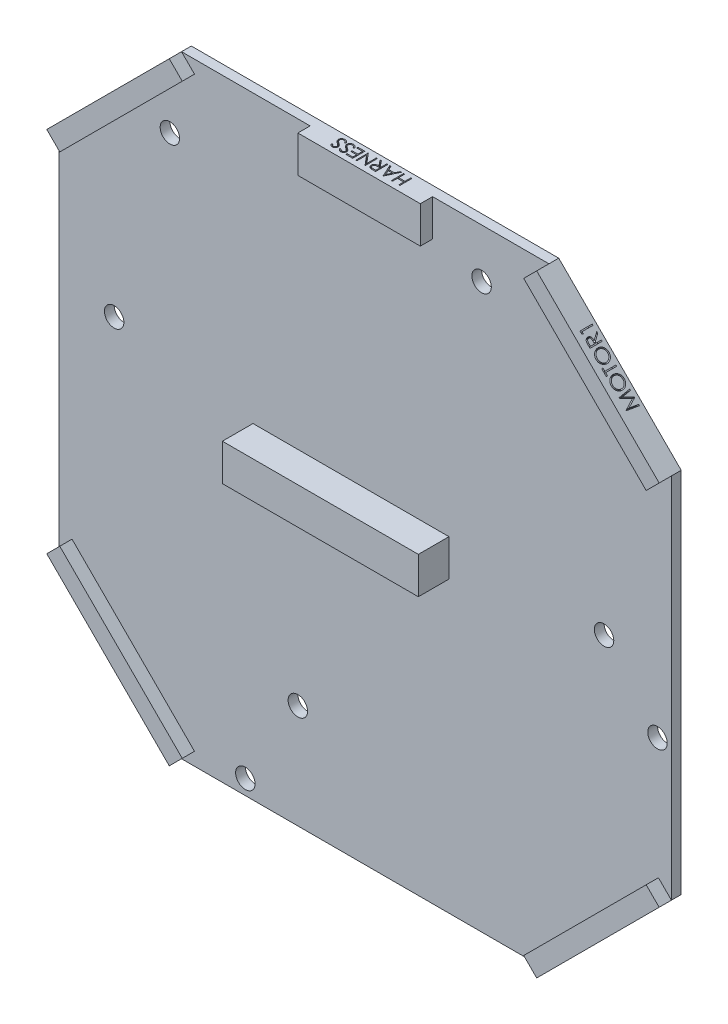
from build123d import *

# Parameters (mm, degrees)
SKETCH1_W           = 100
SKETCH1_H           = 100
BOSS_EXTRUDE1_DEPTH = 1.6
CUT_EXTRUDE1_DEPTH  = 1.6
SKETCH7_R           = 1.5875
CUT_EXTRUDE2_DEPTH  = 1.6
SKETCH8_W           = 32
SKETCH8_H           = 6
BOSS_EXTRUDE2_DEPTH = 5
BOSS_EXTRUDE3_DEPTH = 2
SKETCH12_W          = 20
SKETCH12_H          = 6
BOSS_EXTRUDE5_DEPTH = 2
CUT_EXTRUDE3_DEPTH  = 1
CUT_EXTRUDE4_DEPTH  = 1
CUT_EXTRUDE5_DEPTH  = 1
CUT_EXTRUDE6_DEPTH  = 1
CUT_EXTRUDE7_DEPTH  = 1


with BuildPart() as part:
    # Sketch1 → Boss-Extrude1 (new body)
    with BuildSketch(Plane.XY):
        with Locations((15.275668243, 27.330907947)):
            Rectangle(SKETCH1_W, SKETCH1_H)
    extrude(amount=BOSS_EXTRUDE1_DEPTH)

    # Sketch2 → Cut-Extrude1 (cut)
    with BuildSketch(Plane.XY.offset(1.6)):
        Polygon((-34.724331757, 57.330907947), (-14.724331757, 77.330907947), (-34.724331757, 77.330907947), align=None)
        Polygon((-34.724331757, -2.669092053), (-14.724331757, -22.669092053), (-34.724331757, -22.669092053), align=None)
        Polygon((45.275668243, 77.330907947), (65.275668243, 57.330907947), (65.275668243, 77.330907947), align=None)
        Polygon((65.275668243, -2.669092053), (45.275668243, -22.669092053), (65.275668243, -22.669092053), align=None)
    extrude(amount=-CUT_EXTRUDE1_DEPTH, mode=Mode.SUBTRACT)

    # Sketch7 → Cut-Extrude2 (cut)
    with BuildSketch(Plane.XY.offset(1.6)):
        with Locations((-25.724331757, 34.330907947)):
            Circle(SKETCH7_R)
        with Locations((-16.624331757, 64.904907947)):
            Circle(SKETCH7_R)
        with Locations((34.275668243, 69.330907947)):
            Circle(SKETCH7_R)
        with Locations((54.275668243, 29.330907947)):
            Circle(SKETCH7_R)
        with Locations((62.999668243, 19.180907947)):
            Circle(SKETCH7_R)
        with Locations((-4.300331757, -20.219092053)):
            Circle(SKETCH7_R)
        with Locations((4.275668243, -5.669092053)):
            Circle(SKETCH7_R)
    extrude(amount=-CUT_EXTRUDE2_DEPTH, mode=Mode.SUBTRACT)

    # Sketch8 → Boss-Extrude2 (add)
    with BuildSketch(Plane.XY.offset(1.6)):
        with Locations((12.949668243, 27.580907947)):
            Rectangle(SKETCH8_W, SKETCH8_H)
    extrude(amount=BOSS_EXTRUDE2_DEPTH)

    # Sketch10 → Boss-Extrude3 (add)
    with BuildSketch(Plane.XY.offset(1.6)):
        Polygon((-34.724331757, 57.330907947), (-14.724331757, 77.330907947), (-12.603011413, 75.209587604), (-32.603011413, 55.209587604), align=None)
        Polygon((45.275668243, 77.330907947), (65.275668243, 57.330907947), (63.154347899, 55.209587604), (43.154347899, 75.209587604), align=None)
        Polygon((65.275668243, -2.669092053), (45.275668243, -22.669092053), (43.154347899, -20.547771709), (63.154347899, -0.547771709), align=None)
        Polygon((-14.724331757, -22.669092053), (-34.724331757, -2.669092053), (-32.603011413, -0.547771709), (-12.603011413, -20.547771709), align=None)
    extrude(amount=BOSS_EXTRUDE3_DEPTH)

    # Sketch12 → Boss-Extrude5 (add)
    with BuildSketch(Plane.XY.offset(1.6)):
        with Locations((16.275668243, 74.330907947)):
            Rectangle(SKETCH12_W, SKETCH12_H)
    extrude(amount=BOSS_EXTRUDE5_DEPTH)

    # Sketch13 → Cut-Extrude3 (cut)
    # profile 1 of 7: a face of its own
    with BuildSketch(Plane(origin=(0, 77.330907947, 0), x_dir=(1, 0, 0), z_dir=(0, 1, 0))):
        Polygon((22.027828636, -2.70739316), (21.848341456, -2.70739316), (21.848341456, -1.886880339), (20.822700431, -1.886880339), (20.822700431, -2.70739316), (20.643213251, -2.70739316), (20.643213251, -0.70739316), (20.822700431, -0.70739316), (20.822700431, -1.681752134), (21.848341456, -1.681752134), (21.848341456, -0.70739316), (22.027828636, -0.70739316), align=None)
    # profile 2 of 7: a face of its own
    with BuildSketch(Plane(origin=(0, 77.330907947, 0), x_dir=(1, 0, 0), z_dir=(0, 1, 0))):
        Polygon((19.309879918, -2.70739316), (18.386802995, -0.70739316), (18.581915174, -0.70739316), (18.877588251, -1.348418801), (19.784238892, -1.348418801), (20.088325431, -0.70739316), (20.284238892, -0.70739316), (19.335520943, -2.70739316), align=None)
        Polygon((19.324703636, -2.317569442), (19.686883123, -1.553547006), (18.972139533, -1.553547006), align=None, mode=Mode.SUBTRACT)
    # profile 3 of 7: a face of its own
    with BuildSketch(Plane(origin=(0, 77.330907947, 0), x_dir=(1, 0, 0), z_dir=(0, 1, 0))):
        with BuildLine():
            Line((18.079110687, -2.70739316), (17.678870302, -2.70739316))
            add(Edge.make_bspline(
                [(17.678870302, -2.70739316), (17.652161086, -2.707304253), (17.600876432, -2.707133543), (17.527405992, -2.706181679), (17.460647651, -2.703453476), (17.400636314, -2.701105714), (17.347373083, -2.696824604), (17.300694631, -2.692732806), (17.260815946, -2.687376428), (17.23667546, -2.682401901), (17.225745302, -2.68014957)],
                knots=[0, 0, 0, 0, 1.410062039, 2.707475311, 3.878576406, 4.937260626, 5.877586885, 6.699081471, 7.410979367, 8, 8, 8, 8], degree=3))
            add(Edge.make_bspline(
                [(17.225745302, -2.68014957), (17.211112699, -2.676534676), (17.182159646, -2.669382003), (17.140477469, -2.654256423), (17.100741811, -2.636780922), (17.063098187, -2.616098523), (17.02755646, -2.592558475), (16.994120211, -2.566066147), (16.963237755, -2.536394552), (16.93381034, -2.504772806), (16.908114587, -2.469824137), (16.884981592, -2.433322096), (16.865562236, -2.394563929), (16.850281369, -2.353745123), (16.837470971, -2.31126609), (16.828861188, -2.266707078), (16.823498864, -2.220213062), (16.822969066, -2.188578041), (16.822700431, -2.17253739)],
                knots=[0, 0, 0, 0, 1.027276577, 2.032638556, 3.019345632, 3.985365262, 4.957888996, 5.923693931, 6.890056973, 7.876427719, 8.865527834, 9.843495157, 10.821038291, 11.815616373, 12.812734995, 13.843357168, 14.906466538, 16, 16, 16, 16], degree=3))
            add(Edge.make_bspline(
                [(16.822700431, -2.17253739), (16.823539836, -2.145888729), (16.825177734, -2.093890287), (16.840449526, -2.018427355), (16.865463568, -1.948031894), (16.899938118, -1.882801872), (16.943819789, -1.823974432), (16.996555579, -1.772479133), (17.05787617, -1.728989008), (17.115229629, -1.699150949), (17.165916706, -1.679951862), (17.207767946, -1.666375501), (17.25345524, -1.656062943), (17.302323133, -1.646690269), (17.354749088, -1.639538165), (17.41062753, -1.634458812), (17.470098215, -1.63119275), (17.510863793, -1.630715564), (17.531835046, -1.630470083)],
                knots=[0, 0, 0, 0, 1.260402266, 2.459371274, 3.627181936, 4.786749125, 5.93865593, 7.087644312, 8.261344208, 9.485713728, 10.136162886, 10.825977872, 11.566646758, 12.35154167, 13.181268117, 14.0701832, 15.007234106, 16, 16, 16, 16], degree=3))
            Line((17.531835046, -1.630470083), (16.797059405, -0.70739316))
            Line((16.797059405, -0.70739316), (17.019014533, -0.70739316))
            Line((17.019014533, -0.70739316), (17.753790174, -1.630470083))
            Line((17.753790174, -1.630470083), (17.899623507, -1.630470083))
            Line((17.899623507, -1.630470083), (17.899623507, -0.70739316))
            Line((17.899623507, -0.70739316), (18.079110687, -0.70739316))
            Line((18.079110687, -0.70739316), (18.079110687, -2.70739316))
        make_face()
        with BuildLine():
            Line((17.899623507, -2.502264955), (17.899623507, -1.835598288))
            Line((17.899623507, -1.835598288), (17.53343761, -1.832793801))
            add(Edge.make_bspline(
                [(17.53343761, -1.832793801), (17.516340443, -1.832786233), (17.483201263, -1.832771563), (17.435258055, -1.83505378), (17.390617892, -1.837649762), (17.349452079, -1.841621484), (17.311740376, -1.846737046), (17.277507691, -1.853145905), (17.246678375, -1.860580914), (17.210836866, -1.872206125), (17.170353822, -1.889830011), (17.127265067, -1.917157377), (17.089585186, -1.950205799), (17.058258524, -1.988474098), (17.033096914, -2.03073021), (17.015619934, -2.076017814), (17.004102707, -2.123623362), (17.002833336, -2.156310285), (17.00218761, -2.172938031)],
                knots=[0, 0, 0, 0, 1.146399208, 2.222048177, 3.218135709, 4.144938032, 4.994811973, 5.769438708, 6.479732432, 7.119818093, 8.294689872, 9.430121864, 10.527913442, 11.641375077, 12.733452768, 13.811150417, 14.886538365, 16, 16, 16, 16], degree=3))
            add(Edge.make_bspline(
                [(17.00218761, -2.172938031), (17.002866031, -2.189024933), (17.004210414, -2.220903303), (17.015436555, -2.267467379), (17.033767066, -2.311743704), (17.058856831, -2.353123007), (17.090083734, -2.390406343), (17.126456042, -2.422209082), (17.167117836, -2.448629891), (17.204813965, -2.466062405), (17.238753756, -2.476319724), (17.268086065, -2.4837655), (17.301518031, -2.488980184), (17.338656162, -2.493776301), (17.379663604, -2.497837876), (17.424565346, -2.50053375), (17.473329285, -2.502145079), (17.507127522, -2.502224066), (17.524623507, -2.502264955)],
                knots=[0, 0, 0, 0, 1.100596872, 2.180981401, 3.259506136, 4.371595435, 5.481727359, 6.576991111, 7.667816242, 8.793363246, 9.406619729, 10.09427138, 10.864108636, 11.721733836, 12.6590937, 13.685439239, 14.801845161, 16, 16, 16, 16], degree=3))
            Line((17.524623507, -2.502264955), (17.899623507, -2.502264955))
        make_face(mode=Mode.SUBTRACT)
    # profile 4 of 7: a face of its own
    with BuildSketch(Plane(origin=(0, 77.330907947, 0), x_dir=(1, 0, 0), z_dir=(0, 1, 0))):
        Polygon((16.386802995, -0.70739316), (16.386802995, -2.70739316), (16.349142738, -2.70739316), (15.027828636, -1.13327457), (15.027828636, -2.70739316), (14.848341456, -2.70739316), (14.848341456, -0.70739316), (14.889206841, -0.70739316), (16.207315815, -2.27790598), (16.207315815, -0.70739316), align=None)
    # profile 5 of 7: a face of its own
    with BuildSketch(Plane(origin=(0, 77.330907947, 0), x_dir=(1, 0, 0), z_dir=(0, 1, 0))):
        Polygon((14.335520943, -2.70739316), (13.207315815, -2.70739316), (13.207315815, -2.502264955), (14.156033764, -2.502264955), (14.156033764, -1.886880339), (13.207315815, -1.886880339), (13.207315815, -1.681752134), (14.156033764, -1.681752134), (14.156033764, -0.912521365), (13.207315815, -0.912521365), (13.207315815, -0.70739316), (14.335520943, -0.70739316), align=None)
    # profile 6 of 7: a face of its own
    with BuildSketch(Plane(origin=(0, 77.330907947, 0), x_dir=(1, 0, 0), z_dir=(0, 1, 0))):
        with BuildLine():
            Line((13.053469661, -1.093210467), (12.884399149, -1.194572647))
            add(Edge.make_bspline(
                [(12.884399149, -1.194572647), (12.868674442, -1.168250141), (12.83854651, -1.117817236), (12.78828859, -1.049669784), (12.736212641, -0.991748552), (12.681933022, -0.944390491), (12.625781051, -0.907105412), (12.567390164, -0.880704137), (12.506957129, -0.864237865), (12.465829231, -0.862237816), (12.445296584, -0.861239314)],
                knots=[0, 0, 0, 0, 1.272034388, 2.437168799, 3.508375237, 4.49857839, 5.41946034, 6.295179144, 7.148887113, 8, 8, 8, 8], degree=3))
            add(Edge.make_bspline(
                [(12.445296584, -0.861239314), (12.427764784, -0.861739316), (12.393007948, -0.862730572), (12.341740032, -0.871870468), (12.29219764, -0.886823269), (12.244873855, -0.907093583), (12.201020257, -0.932009593), (12.161954198, -0.961392387), (12.128946089, -0.995335568), (12.101657336, -1.032615285), (12.080295248, -1.072453358), (12.065095614, -1.113868682), (12.055331698, -1.156597348), (12.054093773, -1.18557317), (12.053469661, -1.200181621)],
                knots=[0, 0, 0, 0, 1.095645842, 2.172120455, 3.244862764, 4.326153987, 5.384857088, 6.392105572, 7.372507978, 8.334705661, 9.272564127, 10.189475455, 11.087205874, 12, 12, 12, 12], degree=3))
            add(Edge.make_bspline(
                [(12.053469661, -1.200181621), (12.05429403, -1.216839093), (12.055963467, -1.25057229), (12.070676327, -1.300426814), (12.093142248, -1.349976678), (12.114257688, -1.380632234), (12.125184405, -1.396495724)],
                knots=[0, 0, 0, 0, 0.938992559, 1.901562324, 2.914110574, 4, 4, 4, 4], degree=3))
            add(Edge.make_bspline(
                [(12.125184405, -1.396495724), (12.134112375, -1.407975921), (12.15291055, -1.432147904), (12.185703274, -1.467496882), (12.222990668, -1.504924926), (12.265738116, -1.543684978), (12.313322267, -1.584569906), (12.366282593, -1.626821449), (12.424000699, -1.671069772), (12.46471096, -1.700294517), (12.485761328, -1.71540598)],
                knots=[0, 0, 0, 0, 0.722283655, 1.520795216, 2.39349503, 3.346893347, 4.386874146, 5.510198126, 6.712579003, 8, 8, 8, 8], degree=3))
            add(Edge.make_bspline(
                [(12.485761328, -1.71540598), (12.506800805, -1.730397175), (12.547026682, -1.759059198), (12.603325016, -1.801543011), (12.653600621, -1.840632812), (12.698109678, -1.875784096), (12.735700681, -1.908529984), (12.76774785, -1.937115478), (12.793068846, -1.963067012), (12.807159383, -1.979888709), (12.813485687, -1.987441237)],
                knots=[0, 0, 0, 0, 1.452255772, 2.776602448, 3.96446981, 5.032613149, 5.964194703, 6.766668629, 7.446264616, 8, 8, 8, 8], degree=3))
            add(Edge.make_bspline(
                [(12.813485687, -1.987441237), (12.822325659, -1.999213842), (12.839710652, -2.022366251), (12.862683772, -2.058543556), (12.882057067, -2.095506462), (12.897648947, -2.133388931), (12.91025751, -2.171906252), (12.919023696, -2.2113476), (12.924426988, -2.251445222), (12.924985132, -2.278423431), (12.925264533, -2.291928416)],
                knots=[0, 0, 0, 0, 1.068019517, 2.100403715, 3.106014851, 4.09224787, 5.069873182, 6.043214339, 7.020455327, 8, 8, 8, 8], degree=3))
            add(Edge.make_bspline(
                [(12.925264533, -2.291928416), (12.924521986, -2.3130901), (12.923052763, -2.354961153), (12.910524784, -2.416095323), (12.89098451, -2.474643061), (12.862714212, -2.529301307), (12.827795105, -2.579992577), (12.786346059, -2.625817654), (12.73759085, -2.66519918), (12.683313851, -2.698676625), (12.624597325, -2.72538416), (12.5628897, -2.744844943), (12.498468257, -2.75625015), (12.454689605, -2.757858915), (12.432476072, -2.758675211)],
                knots=[0, 0, 0, 0, 1.005367131, 1.989245246, 2.955191616, 3.932180104, 4.904534562, 5.875498653, 6.859376768, 7.874484044, 8.900379497, 9.918679785, 10.943926428, 12, 12, 12, 12], degree=3))
            add(Edge.make_bspline(
                [(12.432476072, -2.758675211), (12.408900731, -2.757888525), (12.362148011, -2.756328433), (12.293356854, -2.741929573), (12.226729517, -2.719557504), (12.173332935, -2.692912802), (12.13152687, -2.666587878), (12.099678776, -2.642549273), (12.067229369, -2.614934751), (12.034528279, -2.583159308), (12.001252409, -2.547859325), (11.967555117, -2.508735734), (11.933121029, -2.466141177), (11.910976068, -2.435725875), (11.899623507, -2.420133544)],
                knots=[0, 0, 0, 0, 1.286534051, 2.551350862, 3.822568981, 5.117864672, 5.799956111, 6.519305446, 7.295594771, 8.126302591, 9.008831062, 9.944975596, 10.946496709, 12, 12, 12, 12], degree=3))
            Line((11.899623507, -2.420133544), (12.061883123, -2.297136749))
            add(Edge.make_bspline(
                [(12.061883123, -2.297136749), (12.071680084, -2.309759589), (12.090546741, -2.334068227), (12.119201665, -2.368099257), (12.146168689, -2.399227331), (12.172941068, -2.426193313), (12.197455101, -2.451016819), (12.22167024, -2.47189187), (12.24465102, -2.489481185), (12.273551909, -2.508276872), (12.31025612, -2.526461837), (12.355901271, -2.542096573), (12.403633231, -2.551705046), (12.436037405, -2.55292627), (12.452508123, -2.553547006)],
                knots=[0, 0, 0, 0, 1.181426797, 2.275151783, 3.28963443, 4.225459815, 5.084396437, 5.868484344, 6.587427557, 7.222918358, 8.415355282, 9.605213164, 10.782753814, 12, 12, 12, 12], degree=3))
            add(Edge.make_bspline(
                [(12.452508123, -2.553547006), (12.473173869, -2.552865944), (12.513025812, -2.551552579), (12.569472093, -2.536831223), (12.620570063, -2.514448392), (12.664369066, -2.482172584), (12.700533223, -2.443693604), (12.727017621, -2.399811037), (12.742852177, -2.351344449), (12.744790299, -2.317551886), (12.745777354, -2.300341878)],
                knots=[0, 0, 0, 0, 1.144248881, 2.206576175, 3.214949548, 4.222996039, 5.203671638, 6.127710127, 7.046472867, 8, 8, 8, 8], degree=3))
            add(Edge.make_bspline(
                [(12.745777354, -2.300341878), (12.745529261, -2.28963202), (12.74502962, -2.268063112), (12.739072682, -2.236262028), (12.730183202, -2.204835317), (12.71758261, -2.173601914), (12.700458256, -2.141672007), (12.677200377, -2.10922759), (12.648096221, -2.075456664), (12.625759547, -2.053513661), (12.613966456, -2.041928416)],
                knots=[0, 0, 0, 0, 0.858500039, 1.728959331, 2.587258638, 3.476905708, 4.426389682, 5.487945037, 6.673710648, 8, 8, 8, 8], degree=3))
            add(Edge.make_bspline(
                [(12.613966456, -2.041928416), (12.609588529, -2.038021544), (12.599187576, -2.028739711), (12.580172762, -2.013544122), (12.555062591, -1.994799681), (12.524512762, -1.971606928), (12.487959984, -1.944703236), (12.445400238, -1.9144326), (12.397307933, -1.879812338), (12.363181124, -1.855608029), (12.345136328, -1.842809826)],
                knots=[0, 0, 0, 0, 0.420754252, 0.999615792, 1.744751191, 2.668019286, 3.750313428, 4.999500688, 6.413464383, 8, 8, 8, 8], degree=3))
            add(Edge.make_bspline(
                [(12.345136328, -1.842809826), (12.323430107, -1.827014753), (12.281399019, -1.796429781), (12.22159448, -1.750478115), (12.167370157, -1.705536016), (12.118531658, -1.661893405), (12.074609931, -1.61987157), (12.036047733, -1.57899753), (12.002670097, -1.53953933), (11.966245953, -1.48929547), (11.929468365, -1.427016367), (11.897934606, -1.350678324), (11.877873369, -1.274121215), (11.875267967, -1.222732128), (11.873982482, -1.197377134)],
                knots=[0, 0, 0, 0, 1.163604038, 2.253157948, 3.268574773, 4.215621239, 5.091738613, 5.902582348, 6.650434646, 7.330118262, 8.591011492, 9.77460283, 10.902005569, 12, 12, 12, 12], degree=3))
            add(Edge.make_bspline(
                [(11.873982482, -1.197377134), (11.874358581, -1.179446971), (11.875103475, -1.143934837), (11.883643968, -1.09178426), (11.896201479, -1.04115597), (11.914916939, -0.992680013), (11.938311807, -0.94581612), (11.966794873, -0.900646462), (12.001313105, -0.857913224), (12.039658719, -0.816786516), (12.082250995, -0.779591474), (12.127322319, -0.746462435), (12.174619717, -0.718096612), (12.224683316, -0.695811791), (12.276688432, -0.677985841), (12.330879182, -0.665208668), (12.38737201, -0.657340074), (12.425772841, -0.656525337), (12.445296584, -0.656111108)],
                knots=[0, 0, 0, 0, 0.98378539, 1.948466333, 2.894822735, 3.844243623, 4.795447569, 5.768042124, 6.770299647, 7.807997672, 8.852593179, 9.870666288, 10.876941106, 11.874841786, 12.874492863, 13.892063892, 14.928283473, 16, 16, 16, 16], degree=3))
            add(Edge.make_bspline(
                [(12.445296584, -0.656111108), (12.460401828, -0.656406559), (12.49042208, -0.65699374), (12.534706479, -0.662061815), (12.57817768, -0.66949421), (12.620289861, -0.680825912), (12.661567348, -0.69489812), (12.701642388, -0.712127374), (12.740611654, -0.73263841), (12.778523284, -0.756462954), (12.815724277, -0.78392706), (12.852064493, -0.815637264), (12.887725852, -0.851441783), (12.922856486, -0.89129079), (12.956628849, -0.935842961), (12.989892214, -0.984391752), (13.022473378, -1.037094006), (13.042944585, -1.074155601), (13.053469661, -1.093210467)],
                knots=[0, 0, 0, 0, 0.915366252, 1.81920441, 2.69897508, 3.586533125, 4.459536084, 5.340758185, 6.227946952, 7.126403341, 8.052553006, 9.028121456, 10.047063623, 11.114014537, 12.24582441, 13.433687931, 14.680555077, 16, 16, 16, 16], degree=3))
        make_face()
    # profile 7 of 7: a face of its own
    with BuildSketch(Plane(origin=(0, 77.330907947, 0), x_dir=(1, 0, 0), z_dir=(0, 1, 0))):
        with BuildLine():
            Line((11.668854277, -1.093210467), (11.499783764, -1.194572647))
            add(Edge.make_bspline(
                [(11.499783764, -1.194572647), (11.484059057, -1.168250141), (11.453931125, -1.117817236), (11.403673206, -1.049669784), (11.351597256, -0.991748552), (11.297317637, -0.944390491), (11.241165667, -0.907105412), (11.182774779, -0.880704137), (11.122341744, -0.864237865), (11.081213846, -0.862237816), (11.0606812, -0.861239314)],
                knots=[0, 0, 0, 0, 1.272034388, 2.437168799, 3.508375237, 4.49857839, 5.41946034, 6.295179144, 7.148887113, 8, 8, 8, 8], degree=3))
            add(Edge.make_bspline(
                [(11.0606812, -0.861239314), (11.043149399, -0.861739316), (11.008392563, -0.862730572), (10.957124647, -0.871870468), (10.907582255, -0.886823269), (10.860258471, -0.907093583), (10.816404873, -0.932009593), (10.777338813, -0.961392387), (10.744330705, -0.995335568), (10.717041951, -1.032615285), (10.695679863, -1.072453358), (10.680480229, -1.113868682), (10.670716313, -1.156597348), (10.669478389, -1.18557317), (10.668854277, -1.200181621)],
                knots=[0, 0, 0, 0, 1.095645842, 2.172120455, 3.244862764, 4.326153987, 5.384857088, 6.392105572, 7.372507978, 8.334705661, 9.272564127, 10.189475455, 11.087205874, 12, 12, 12, 12], degree=3))
            add(Edge.make_bspline(
                [(10.668854277, -1.200181621), (10.669678646, -1.216839093), (10.671348083, -1.25057229), (10.686060942, -1.300426814), (10.708526863, -1.349976678), (10.729642304, -1.380632234), (10.74056902, -1.396495724)],
                knots=[0, 0, 0, 0, 0.938992559, 1.901562324, 2.914110574, 4, 4, 4, 4], degree=3))
            add(Edge.make_bspline(
                [(10.74056902, -1.396495724), (10.74949699, -1.407975921), (10.768295165, -1.432147904), (10.80108789, -1.467496882), (10.838375284, -1.504924926), (10.881122731, -1.543684978), (10.928706883, -1.584569906), (10.981667209, -1.626821449), (11.039385314, -1.671069772), (11.080095576, -1.700294517), (11.101145943, -1.71540598)],
                knots=[0, 0, 0, 0, 0.722283655, 1.520795216, 2.39349503, 3.346893347, 4.386874146, 5.510198126, 6.712579003, 8, 8, 8, 8], degree=3))
            add(Edge.make_bspline(
                [(11.101145943, -1.71540598), (11.12218542, -1.730397175), (11.162411297, -1.759059198), (11.218709631, -1.801543011), (11.268985237, -1.840632812), (11.313494294, -1.875784096), (11.351085296, -1.908529984), (11.383132466, -1.937115478), (11.408453462, -1.963067012), (11.422543999, -1.979888709), (11.428870302, -1.987441237)],
                knots=[0, 0, 0, 0, 1.452255772, 2.776602448, 3.96446981, 5.032613149, 5.964194703, 6.766668629, 7.446264616, 8, 8, 8, 8], degree=3))
            add(Edge.make_bspline(
                [(11.428870302, -1.987441237), (11.437710275, -1.999213842), (11.455095267, -2.022366251), (11.478068388, -2.058543556), (11.497441682, -2.095506462), (11.513033563, -2.133388931), (11.525642126, -2.171906252), (11.534408312, -2.2113476), (11.539811603, -2.251445222), (11.540369748, -2.278423431), (11.540649149, -2.291928416)],
                knots=[0, 0, 0, 0, 1.068019517, 2.100403715, 3.106014851, 4.09224787, 5.069873182, 6.043214339, 7.020455327, 8, 8, 8, 8], degree=3))
            add(Edge.make_bspline(
                [(11.540649149, -2.291928416), (11.539906601, -2.3130901), (11.538437378, -2.354961153), (11.5259094, -2.416095323), (11.506369125, -2.474643061), (11.478098827, -2.529301307), (11.44317972, -2.579992577), (11.401730674, -2.625817654), (11.352975465, -2.66519918), (11.298698466, -2.698676625), (11.23998194, -2.72538416), (11.178274315, -2.744844943), (11.113852872, -2.75625015), (11.070074221, -2.757858915), (11.047860687, -2.758675211)],
                knots=[0, 0, 0, 0, 1.005367131, 1.989245246, 2.955191616, 3.932180104, 4.904534562, 5.875498653, 6.859376768, 7.874484044, 8.900379497, 9.918679785, 10.943926428, 12, 12, 12, 12], degree=3))
            add(Edge.make_bspline(
                [(11.047860687, -2.758675211), (11.024285346, -2.757888525), (10.977532626, -2.756328433), (10.90874147, -2.741929573), (10.842114132, -2.719557504), (10.78871755, -2.692912802), (10.746911485, -2.666587878), (10.715063392, -2.642549273), (10.682613985, -2.614934751), (10.649912894, -2.583159308), (10.616637025, -2.547859325), (10.582939732, -2.508735734), (10.548505644, -2.466141177), (10.526360684, -2.435725875), (10.515008123, -2.420133544)],
                knots=[0, 0, 0, 0, 1.286534051, 2.551350862, 3.822568981, 5.117864672, 5.799956111, 6.519305446, 7.295594771, 8.126302591, 9.008831062, 9.944975596, 10.946496709, 12, 12, 12, 12], degree=3))
            Line((10.515008123, -2.420133544), (10.677267738, -2.297136749))
            add(Edge.make_bspline(
                [(10.677267738, -2.297136749), (10.6870647, -2.309759589), (10.705931356, -2.334068227), (10.734586281, -2.368099257), (10.761553305, -2.399227331), (10.788325683, -2.426193313), (10.812839716, -2.451016819), (10.837054855, -2.47189187), (10.860035635, -2.489481185), (10.888936525, -2.508276872), (10.925640736, -2.526461837), (10.971285886, -2.542096573), (11.019017847, -2.551705046), (11.051422021, -2.55292627), (11.067892738, -2.553547006)],
                knots=[0, 0, 0, 0, 1.181426797, 2.275151783, 3.28963443, 4.225459815, 5.084396437, 5.868484344, 6.587427557, 7.222918358, 8.415355282, 9.605213164, 10.782753814, 12, 12, 12, 12], degree=3))
            add(Edge.make_bspline(
                [(11.067892738, -2.553547006), (11.088558484, -2.552865944), (11.128410428, -2.551552579), (11.184856708, -2.536831223), (11.235954678, -2.514448392), (11.279753681, -2.482172584), (11.315917839, -2.443693604), (11.342402237, -2.399811037), (11.358236793, -2.351344449), (11.360174915, -2.317551886), (11.361161969, -2.300341878)],
                knots=[0, 0, 0, 0, 1.144248881, 2.206576175, 3.214949548, 4.222996039, 5.203671638, 6.127710127, 7.046472867, 8, 8, 8, 8], degree=3))
            add(Edge.make_bspline(
                [(11.361161969, -2.300341878), (11.360913876, -2.28963202), (11.360414235, -2.268063112), (11.354457298, -2.236262028), (11.345567818, -2.204835317), (11.332967226, -2.173601914), (11.315842871, -2.141672007), (11.292584992, -2.10922759), (11.263480836, -2.075456664), (11.241144162, -2.053513661), (11.229351072, -2.041928416)],
                knots=[0, 0, 0, 0, 0.858500039, 1.728959331, 2.587258638, 3.476905708, 4.426389682, 5.487945037, 6.673710648, 8, 8, 8, 8], degree=3))
            add(Edge.make_bspline(
                [(11.229351072, -2.041928416), (11.224973144, -2.038021544), (11.214572192, -2.028739711), (11.195557377, -2.013544122), (11.170447207, -1.994799681), (11.139897377, -1.971606928), (11.103344599, -1.944703236), (11.060784853, -1.9144326), (11.012692549, -1.879812338), (10.978565739, -1.855608029), (10.960520943, -1.842809826)],
                knots=[0, 0, 0, 0, 0.420754252, 0.999615792, 1.744751191, 2.668019286, 3.750313428, 4.999500688, 6.413464383, 8, 8, 8, 8], degree=3))
            add(Edge.make_bspline(
                [(10.960520943, -1.842809826), (10.938814723, -1.827014753), (10.896783634, -1.796429781), (10.836979096, -1.750478115), (10.782754772, -1.705536016), (10.733916273, -1.661893405), (10.689994546, -1.61987157), (10.651432348, -1.57899753), (10.618054713, -1.53953933), (10.581630569, -1.48929547), (10.544852981, -1.427016367), (10.513319222, -1.350678324), (10.493257984, -1.274121215), (10.490652583, -1.222732128), (10.489367097, -1.197377134)],
                knots=[0, 0, 0, 0, 1.163604038, 2.253157948, 3.268574773, 4.215621239, 5.091738613, 5.902582348, 6.650434646, 7.330118262, 8.591011492, 9.77460283, 10.902005569, 12, 12, 12, 12], degree=3))
            add(Edge.make_bspline(
                [(10.489367097, -1.197377134), (10.489743196, -1.179446971), (10.490488091, -1.143934837), (10.499028583, -1.09178426), (10.511586094, -1.04115597), (10.530301554, -0.992680013), (10.553696423, -0.94581612), (10.582179488, -0.900646462), (10.61669772, -0.857913224), (10.655043335, -0.816786516), (10.697635611, -0.779591474), (10.742706935, -0.746462435), (10.790004332, -0.718096612), (10.840067931, -0.695811791), (10.892073047, -0.677985841), (10.946263797, -0.665208668), (11.002756625, -0.657340074), (11.041157456, -0.656525337), (11.0606812, -0.656111108)],
                knots=[0, 0, 0, 0, 0.98378539, 1.948466333, 2.894822735, 3.844243623, 4.795447569, 5.768042124, 6.770299647, 7.807997672, 8.852593179, 9.870666288, 10.876941106, 11.874841786, 12.874492863, 13.892063892, 14.928283473, 16, 16, 16, 16], degree=3))
            add(Edge.make_bspline(
                [(11.0606812, -0.656111108), (11.075786443, -0.656406559), (11.105806695, -0.65699374), (11.150091095, -0.662061815), (11.193562295, -0.66949421), (11.235674477, -0.680825912), (11.276951963, -0.69489812), (11.317027004, -0.712127374), (11.35599627, -0.73263841), (11.393907899, -0.756462954), (11.431108892, -0.78392706), (11.467449109, -0.815637264), (11.503110467, -0.851441783), (11.538241101, -0.89129079), (11.572013464, -0.935842961), (11.605276829, -0.984391752), (11.637857993, -1.037094006), (11.6583292, -1.074155601), (11.668854277, -1.093210467)],
                knots=[0, 0, 0, 0, 0.915366252, 1.81920441, 2.69897508, 3.586533125, 4.459536084, 5.340758185, 6.227946952, 7.126403341, 8.052553006, 9.028121456, 10.047063623, 11.114014537, 12.24582441, 13.433687931, 14.680555077, 16, 16, 16, 16], degree=3))
        make_face()
    extrude(amount=-CUT_EXTRUDE3_DEPTH, mode=Mode.SUBTRACT)

    # Sketch14 → Cut-Extrude4 (cut)
    # profile 1 of 6: a face of its own
    with BuildSketch(Plane(origin=(61.303288095, 61.303288095, 0), x_dir=(-0.7071067811865475, 0.7071067811865477, 0), z_dir=(0.7071067811865477, 0.7071067811865475, 0))):
        Polygon((3.250364479, 0.549455025), (3.514386915, 2.549455025), (3.54002794, 2.549455025), (4.365749094, 0.908429384), (5.189467043, 2.549455025), (5.215508709, 2.549455025), (5.481133709, 0.549455025), (5.300845248, 0.549455025), (5.109338838, 1.988557589), (4.387383709, 0.549455025), (4.346918966, 0.549455025), (3.62215935, 1.991762718), (3.431053581, 0.549455025), align=None)
    # profile 2 of 6: a face of its own
    with BuildSketch(Plane(origin=(61.303288095, 61.303288095, 0), x_dir=(-0.7071067811865475, 0.7071067811865477, 0), z_dir=(0.7071067811865477, 0.7071067811865475, 0))):
        with BuildLine():
            add(Edge.make_bspline(
                [(6.827287556, 2.600737077), (6.864320759, 2.599799088), (6.937057026, 2.597956802), (7.043956967, 2.583854457), (7.146011308, 2.559457092), (7.244051387, 2.526963959), (7.336904516, 2.483618596), (7.425269598, 2.431227082), (7.508936383, 2.369240534), (7.586777172, 2.298138119), (7.658009715, 2.220776145), (7.720767365, 2.13821734), (7.773362961, 2.050960881), (7.816554839, 1.959268978), (7.850439759, 1.863348996), (7.87382207, 1.762689566), (7.888758156, 1.657942886), (7.890504314, 1.586498963), (7.89139012, 1.550256307)],
                knots=[0, 0, 0, 0, 1.065120563, 2.091984664, 3.0946048, 4.079830382, 5.057816894, 6.036188127, 7.030412546, 8.04752943, 9.064399622, 10.05169764, 11.02544977, 11.989514704, 12.962713494, 13.945757189, 14.957906945, 16, 16, 16, 16], degree=3))
            add(Edge.make_bspline(
                [(7.89139012, 1.550256307), (7.890504444, 1.514280624), (7.888758675, 1.443368383), (7.873805087, 1.339286415), (7.850353087, 1.239234589), (7.816869507, 1.14337993), (7.773883519, 1.051621322), (7.720937707, 0.964200206), (7.658571301, 0.881087921), (7.587595957, 0.803194969), (7.510223933, 0.731767843), (7.427235209, 0.669528486), (7.340496169, 0.615971843), (7.248890622, 0.573238315), (7.153633458, 0.539082932), (7.053872131, 0.515795715), (6.9500741, 0.500774547), (6.879290669, 0.499049681), (6.843313197, 0.498172974)],
                knots=[0, 0, 0, 0, 1.043624062, 2.057103931, 3.04512605, 4.022047818, 4.998200453, 5.980619268, 6.982898556, 8.009068085, 9.034988726, 10.034168286, 11.015286542, 11.987931943, 12.962482838, 13.94673481, 14.956375938, 16, 16, 16, 16], degree=3))
            add(Edge.make_bspline(
                [(6.843313197, 0.498172974), (6.807070729, 0.499058338), (6.735627177, 0.500803626), (6.630748871, 0.515764429), (6.530018731, 0.539159459), (6.433724816, 0.572593423), (6.341813428, 0.615803269), (6.254104809, 0.668491486), (6.170951011, 0.731009852), (6.093041442, 0.80196218), (6.021756185, 0.879203067), (5.959607971, 0.961965499), (5.906907906, 1.04862576), (5.863843145, 1.139424345), (5.829749168, 1.233922312), (5.806489272, 1.332750014), (5.791440156, 1.435344017), (5.789705958, 1.505197102), (5.788826017, 1.540640923)],
                knots=[0, 0, 0, 0, 1.053102029, 2.075944431, 3.073151272, 4.055350789, 5.033113405, 6.020478099, 7.024410459, 8.052272461, 9.079885166, 10.07527673, 11.055994387, 12.023226415, 12.992069828, 13.970394897, 14.97016774, 16, 16, 16, 16], degree=3))
            add(Edge.make_bspline(
                [(5.788826017, 1.540640923), (5.789131523, 1.564431019), (5.789738681, 1.61171109), (5.79704822, 1.681920576), (5.807654906, 1.751000952), (5.822855999, 1.818755779), (5.842736951, 1.885019199), (5.866195253, 1.950248206), (5.894846593, 2.013781763), (5.927235535, 2.075920844), (5.963385139, 2.13569679), (6.003314139, 2.192199409), (6.045620064, 2.245902835), (6.091999146, 2.295415409), (6.140922829, 2.342177498), (6.193184759, 2.38547048), (6.248466042, 2.425684737), (6.307004545, 2.461924932), (6.367357844, 2.494701581), (6.429573146, 2.522828353), (6.492805473, 2.546968959), (6.557350986, 2.566535145), (6.623038284, 2.581982023), (6.690010732, 2.59250051), (6.758214976, 2.599828692), (6.804164301, 2.600432979), (6.827287556, 2.600737077)],
                knots=[0, 0, 0, 0, 1.037015668, 2.060948919, 3.074880161, 4.083647147, 5.086022904, 6.090072063, 7.104153813, 8.122640571, 9.144368836, 10.147691507, 11.138137339, 12.123020368, 13.103399296, 14.087645067, 15.080126199, 16.082011238, 17.087798457, 18.072939717, 19.057185487, 20.037253025, 21.01195951, 21.997135196, 22.992090687, 24, 24, 24, 24], degree=3))
        make_face()
        with BuildLine():
            add(Edge.make_bspline(
                [(6.836101658, 2.395608871), (6.817121868, 2.395377506), (6.779343734, 2.394916986), (6.723181142, 2.388850863), (6.66775718, 2.380205212), (6.613060402, 2.367872914), (6.559319665, 2.351070598), (6.506034041, 2.331732936), (6.453689439, 2.308178028), (6.402458663, 2.281565054), (6.352792906, 2.252108527), (6.305928505, 2.219553232), (6.261744137, 2.18466263), (6.220347985, 2.147355294), (6.181861601, 2.107441236), (6.145527486, 2.065525558), (6.11280201, 2.020410192), (6.082810252, 1.973318531), (6.055971486, 1.924311913), (6.032105569, 1.873906277), (6.012583279, 1.821690456), (5.996661921, 1.768230938), (5.983462029, 1.713612389), (5.975099787, 1.657420476), (5.96896701, 1.599937554), (5.968532812, 1.561090781), (5.968313197, 1.541442205)],
                knots=[0, 0, 0, 0, 1.008559885, 2.007477868, 2.99961109, 3.989939068, 4.984837346, 5.991145699, 7.001802488, 8.033829008, 9.059044045, 10.069351652, 11.065060232, 12.050310815, 13.029377138, 14.011219647, 14.996725999, 15.989392538, 16.977580475, 17.965360261, 18.951710183, 19.937753436, 20.929683414, 21.935841486, 22.955955122, 24, 24, 24, 24], degree=3))
            add(Edge.make_bspline(
                [(5.968313197, 1.541442205), (5.969041689, 1.512549507), (5.970474859, 1.455708633), (5.983022042, 1.372412551), (6.002348885, 1.292362101), (6.030838809, 1.215995296), (6.066467731, 1.142655706), (6.110483097, 1.072993932), (6.162631146, 1.006991146), (6.221867447, 0.945108135), (6.286623279, 0.888624819), (6.355384839, 0.839045728), (6.427415472, 0.797097014), (6.502903016, 0.762922687), (6.581444467, 0.735842837), (6.663545925, 0.717283619), (6.748660473, 0.705069073), (6.806677991, 0.703896069), (6.836101658, 0.703301179)],
                knots=[0, 0, 0, 0, 1.032063989, 2.030389145, 3.003944642, 3.970395727, 4.937377036, 5.913328081, 6.909231446, 7.93887556, 8.970685674, 9.976071282, 10.964166581, 11.944589148, 12.933237628, 13.927779006, 14.949070134, 16, 16, 16, 16], degree=3))
            add(Edge.make_bspline(
                [(6.836101658, 0.703301179), (6.855878516, 0.703572896), (6.895101966, 0.704111792), (6.953442264, 0.709539607), (7.010731528, 0.718243533), (7.066889402, 0.730775336), (7.121852152, 0.746459454), (7.175849182, 0.765092441), (7.228305348, 0.788338843), (7.279882398, 0.814023387), (7.329251679, 0.843303477), (7.376380554, 0.874753848), (7.420081114, 0.90959306), (7.461446298, 0.946346096), (7.500090692, 0.985754009), (7.535752968, 1.027765564), (7.568313044, 1.07264594), (7.598293414, 1.119666172), (7.625038135, 1.168806888), (7.648340477, 1.219395275), (7.668109686, 1.271306766), (7.684068832, 1.324616235), (7.69657481, 1.379222435), (7.705191907, 1.435198479), (7.711219586, 1.492432389), (7.711673916, 1.531143164), (7.71190294, 1.550656948)],
                knots=[0, 0, 0, 0, 1.047197238, 2.076906641, 3.100256066, 4.114471768, 5.12198147, 6.126382909, 7.136867548, 8.15857795, 9.17633901, 10.174870724, 11.156907918, 12.133735059, 13.104061851, 14.077631395, 15.04955518, 16.038496417, 17.029181396, 18.010275684, 18.986308667, 19.968651475, 20.955262928, 21.950658345, 22.966943676, 24, 24, 24, 24], degree=3))
            add(Edge.make_bspline(
                [(7.71190294, 1.550656948), (7.711673733, 1.570037237), (7.711219058, 1.608481608), (7.705194786, 1.665316361), (7.696565706, 1.720889625), (7.684129873, 1.774983227), (7.668101214, 1.827610955), (7.648337025, 1.878723383), (7.62503114, 1.928510923), (7.598283583, 1.976850521), (7.568217398, 2.023236086), (7.535363545, 2.067580321), (7.499154774, 2.109050459), (7.460625617, 2.148670284), (7.418813683, 2.185594793), (7.373908372, 2.219836233), (7.326454842, 2.252220961), (7.276210707, 2.281435568), (7.224357019, 2.30841513), (7.171149043, 2.331529989), (7.117189558, 2.3511712), (7.062615779, 2.367923751), (7.006968363, 2.380156911), (6.950623318, 2.388858654), (6.893658599, 2.394914874), (6.855348188, 2.395376805), (6.836101658, 2.395608871)],
                knots=[0, 0, 0, 0, 1.02996197, 2.043119294, 3.035359645, 4.018872909, 4.991431989, 5.957985074, 6.929999688, 7.912076566, 8.892894881, 9.867085534, 10.843653904, 11.817741046, 12.803660682, 13.806313499, 14.818574707, 15.856120519, 16.894564902, 17.924820532, 18.937903209, 19.946497019, 20.957711757, 21.963978472, 22.977135795, 24, 24, 24, 24], degree=3))
        make_face(mode=Mode.SUBTRACT)
    # profile 3 of 6: a face of its own
    with BuildSketch(Plane(origin=(61.303288095, 61.303288095, 0), x_dir=(-0.7071067811865475, 0.7071067811865477, 0), z_dir=(0.7071067811865477, 0.7071067811865475, 0))):
        Polygon((8.070877299, 2.34432682), (8.070877299, 2.549455025), (9.12215935, 2.549455025), (9.12215935, 2.34432682), (8.686261915, 2.34432682), (8.686261915, 0.549455025), (8.506774735, 0.549455025), (8.506774735, 2.34432682), align=None)
    # profile 4 of 6: a face of its own
    with BuildSketch(Plane(origin=(61.303288095, 61.303288095, 0), x_dir=(-0.7071067811865475, 0.7071067811865477, 0), z_dir=(0.7071067811865477, 0.7071067811865475, 0))):
        with BuildLine():
            add(Edge.make_bspline(
                [(10.365749094, 2.600737077), (10.402782297, 2.599799088), (10.475518564, 2.597956802), (10.582418506, 2.583854457), (10.684472846, 2.559457092), (10.782512925, 2.526963959), (10.875366055, 2.483618596), (10.963731136, 2.431227082), (11.047397921, 2.369240534), (11.125238711, 2.298138119), (11.196471254, 2.220776145), (11.259228903, 2.13821734), (11.311824499, 2.050960881), (11.355016378, 1.959268978), (11.388901298, 1.863348996), (11.412283608, 1.762689566), (11.427219694, 1.657942886), (11.428965853, 1.586498963), (11.429851658, 1.550256307)],
                knots=[0, 0, 0, 0, 1.065120563, 2.091984664, 3.0946048, 4.079830382, 5.057816894, 6.036188127, 7.030412546, 8.04752943, 9.064399622, 10.05169764, 11.02544977, 11.989514704, 12.962713494, 13.945757189, 14.957906945, 16, 16, 16, 16], degree=3))
            add(Edge.make_bspline(
                [(11.429851658, 1.550256307), (11.428965982, 1.514280624), (11.427220213, 1.443368383), (11.412266626, 1.339286415), (11.388814626, 1.239234589), (11.355331045, 1.14337993), (11.312345057, 1.051621322), (11.259399245, 0.964200206), (11.197032839, 0.881087921), (11.126057496, 0.803194969), (11.048685472, 0.731767843), (10.965696748, 0.669528486), (10.878957708, 0.615971843), (10.78735216, 0.573238315), (10.692094997, 0.539082932), (10.592333669, 0.515795715), (10.488535638, 0.500774547), (10.417752207, 0.499049681), (10.381774735, 0.498172974)],
                knots=[0, 0, 0, 0, 1.043624062, 2.057103931, 3.04512605, 4.022047818, 4.998200453, 5.980619268, 6.982898556, 8.009068085, 9.034988726, 10.034168286, 11.015286542, 11.987931943, 12.962482838, 13.94673481, 14.956375938, 16, 16, 16, 16], degree=3))
            add(Edge.make_bspline(
                [(10.381774735, 0.498172974), (10.345532267, 0.499058338), (10.274088715, 0.500803626), (10.169210409, 0.515764429), (10.06848027, 0.539159459), (9.972186355, 0.572593423), (9.880274967, 0.615803269), (9.792566348, 0.668491486), (9.709412549, 0.731009852), (9.63150298, 0.80196218), (9.560217724, 0.879203067), (9.498069509, 0.961965499), (9.445369444, 1.04862576), (9.402304683, 1.139424345), (9.368210706, 1.233922312), (9.34495081, 1.332750014), (9.329901695, 1.435344017), (9.328167497, 1.505197102), (9.327287556, 1.540640923)],
                knots=[0, 0, 0, 0, 1.053102029, 2.075944431, 3.073151272, 4.055350789, 5.033113405, 6.020478099, 7.024410459, 8.052272461, 9.079885166, 10.07527673, 11.055994387, 12.023226415, 12.992069828, 13.970394897, 14.97016774, 16, 16, 16, 16], degree=3))
            add(Edge.make_bspline(
                [(9.327287556, 1.540640923), (9.327593062, 1.564431019), (9.32820022, 1.61171109), (9.335509758, 1.681920576), (9.346116444, 1.751000952), (9.361317537, 1.818755779), (9.38119849, 1.885019199), (9.404656791, 1.950248206), (9.433308132, 2.013781763), (9.465697073, 2.075920844), (9.501846678, 2.13569679), (9.541775678, 2.192199409), (9.584081602, 2.245902835), (9.630460684, 2.295415409), (9.679384367, 2.342177498), (9.731646298, 2.38547048), (9.78692758, 2.425684737), (9.845466083, 2.461924932), (9.905819383, 2.494701581), (9.968034684, 2.522828353), (10.031267011, 2.546968959), (10.095812524, 2.566535145), (10.161499823, 2.581982023), (10.228472271, 2.59250051), (10.296676514, 2.599828692), (10.34262584, 2.600432979), (10.365749094, 2.600737077)],
                knots=[0, 0, 0, 0, 1.037015668, 2.060948919, 3.074880161, 4.083647147, 5.086022904, 6.090072063, 7.104153813, 8.122640571, 9.144368836, 10.147691507, 11.138137339, 12.123020368, 13.103399296, 14.087645067, 15.080126199, 16.082011238, 17.087798457, 18.072939717, 19.057185487, 20.037253025, 21.01195951, 21.997135196, 22.992090687, 24, 24, 24, 24], degree=3))
        make_face()
        with BuildLine():
            add(Edge.make_bspline(
                [(10.374563197, 2.395608871), (10.355583406, 2.395377506), (10.317805273, 2.394916986), (10.261642681, 2.388850863), (10.206218719, 2.380205212), (10.15152194, 2.367872914), (10.097781203, 2.351070598), (10.04449558, 2.331732936), (9.992150978, 2.308178028), (9.940920202, 2.281565054), (9.891254445, 2.252108527), (9.844390044, 2.219553232), (9.800205676, 2.18466263), (9.758809523, 2.147355294), (9.720323139, 2.107441236), (9.683989024, 2.065525558), (9.651263549, 2.020410192), (9.621271791, 1.973318531), (9.594433025, 1.924311913), (9.570567108, 1.873906277), (9.551044817, 1.821690456), (9.535123459, 1.768230938), (9.521923567, 1.713612389), (9.513561325, 1.657420476), (9.507428548, 1.599937554), (9.506994351, 1.561090781), (9.506774735, 1.541442205)],
                knots=[0, 0, 0, 0, 1.008559885, 2.007477868, 2.99961109, 3.989939068, 4.984837346, 5.991145699, 7.001802488, 8.033829008, 9.059044045, 10.069351652, 11.065060232, 12.050310815, 13.029377138, 14.011219647, 14.996725999, 15.989392538, 16.977580475, 17.965360261, 18.951710183, 19.937753436, 20.929683414, 21.935841486, 22.955955122, 24, 24, 24, 24], degree=3))
            add(Edge.make_bspline(
                [(9.506774735, 1.541442205), (9.507503228, 1.512549507), (9.508936398, 1.455708633), (9.521483581, 1.372412551), (9.540810423, 1.292362101), (9.569300347, 1.215995296), (9.60492927, 1.142655706), (9.648944636, 1.072993932), (9.701092684, 1.006991146), (9.760328985, 0.945108135), (9.825084818, 0.888624819), (9.893846378, 0.839045728), (9.965877011, 0.797097014), (10.041364555, 0.762922687), (10.119906006, 0.735842837), (10.202007464, 0.717283619), (10.287122012, 0.705069073), (10.345139529, 0.703896069), (10.374563197, 0.703301179)],
                knots=[0, 0, 0, 0, 1.032063989, 2.030389145, 3.003944642, 3.970395727, 4.937377036, 5.913328081, 6.909231446, 7.93887556, 8.970685674, 9.976071282, 10.964166581, 11.944589148, 12.933237628, 13.927779006, 14.949070134, 16, 16, 16, 16], degree=3))
            add(Edge.make_bspline(
                [(10.374563197, 0.703301179), (10.394340055, 0.703572896), (10.433563504, 0.704111792), (10.491903803, 0.709539607), (10.549193066, 0.718243533), (10.605350941, 0.730775336), (10.66031369, 0.746459454), (10.71431072, 0.765092441), (10.766766886, 0.788338843), (10.818343936, 0.814023387), (10.867713217, 0.843303477), (10.914842093, 0.874753848), (10.958542653, 0.90959306), (10.999907837, 0.946346096), (11.03855223, 0.985754009), (11.074214507, 1.027765564), (11.106774582, 1.07264594), (11.136754952, 1.119666172), (11.163499674, 1.168806888), (11.186802016, 1.219395275), (11.206571225, 1.271306766), (11.222530371, 1.324616235), (11.235036349, 1.379222435), (11.243653446, 1.435198479), (11.249681125, 1.492432389), (11.250135455, 1.531143164), (11.250364479, 1.550656948)],
                knots=[0, 0, 0, 0, 1.047197238, 2.076906641, 3.100256066, 4.114471768, 5.12198147, 6.126382909, 7.136867548, 8.15857795, 9.17633901, 10.174870724, 11.156907918, 12.133735059, 13.104061851, 14.077631395, 15.04955518, 16.038496417, 17.029181396, 18.010275684, 18.986308667, 19.968651475, 20.955262928, 21.950658345, 22.966943676, 24, 24, 24, 24], degree=3))
            add(Edge.make_bspline(
                [(11.250364479, 1.550656948), (11.250135271, 1.570037237), (11.249680596, 1.608481608), (11.243656325, 1.665316361), (11.235027245, 1.720889625), (11.222591412, 1.774983227), (11.206562752, 1.827610955), (11.186798563, 1.878723383), (11.163492678, 1.928510923), (11.136745121, 1.976850521), (11.106678936, 2.023236086), (11.073825083, 2.067580321), (11.037616313, 2.109050459), (10.999087156, 2.148670284), (10.957275221, 2.185594793), (10.91236991, 2.219836233), (10.86491638, 2.252220961), (10.814672246, 2.281435568), (10.762818558, 2.30841513), (10.709610582, 2.331529989), (10.655651096, 2.3511712), (10.601077318, 2.367923751), (10.545429902, 2.380156911), (10.489084857, 2.388858654), (10.432120137, 2.394914874), (10.393809726, 2.395376805), (10.374563197, 2.395608871)],
                knots=[0, 0, 0, 0, 1.02996197, 2.043119294, 3.035359645, 4.018872909, 4.991431989, 5.957985074, 6.929999688, 7.912076566, 8.892894881, 9.867085534, 10.843653904, 11.817741046, 12.803660682, 13.806313499, 14.818574707, 15.856120519, 16.894564902, 17.924820532, 18.937903209, 19.946497019, 20.957711757, 21.963978472, 22.977135795, 24, 24, 24, 24], degree=3))
        make_face(mode=Mode.SUBTRACT)
    # profile 5 of 6: a face of its own
    with BuildSketch(Plane(origin=(61.303288095, 61.303288095, 0), x_dir=(-0.7071067811865475, 0.7071067811865477, 0), z_dir=(0.7071067811865477, 0.7071067811865475, 0))):
        with BuildLine():
            Line((11.840108068, 2.549455025), (12.240348453, 2.549455025))
            add(Edge.make_bspline(
                [(12.240348453, 2.549455025), (12.267057669, 2.549366119), (12.318342323, 2.549195409), (12.391812764, 2.548243545), (12.458571105, 2.545515341), (12.518582441, 2.543167579), (12.571845673, 2.53888647), (12.618524125, 2.534794672), (12.658402809, 2.529438294), (12.682543295, 2.524463767), (12.693473453, 2.522211436)],
                knots=[0, 0, 0, 0, 1.410062039, 2.707475311, 3.878576406, 4.937260626, 5.877586885, 6.699081471, 7.410979367, 8, 8, 8, 8], degree=3))
            add(Edge.make_bspline(
                [(12.693473453, 2.522211436), (12.70810581, 2.518596141), (12.737058375, 2.511442676), (12.778744127, 2.496322904), (12.818466598, 2.478825976), (12.856060783, 2.458275279), (12.891338378, 2.434518262), (12.924663127, 2.407965049), (12.956186249, 2.378760931), (12.984632895, 2.346169593), (13.01145521, 2.311977302), (13.034077283, 2.275003727), (13.053578128, 2.236339997), (13.069104138, 2.195592901), (13.081605837, 2.153157603), (13.090420831, 2.108649719), (13.095707224, 2.062272019), (13.096245427, 2.030638928), (13.096518325, 2.014599256)],
                knots=[0, 0, 0, 0, 1.027469482, 2.033020251, 3.019912614, 3.986113645, 4.951240523, 5.91722682, 6.890402269, 7.87763091, 8.8651537, 9.85103654, 10.82876324, 11.815024772, 12.821070561, 13.842952187, 14.906261191, 16, 16, 16, 16], degree=3))
            add(Edge.make_bspline(
                [(13.096518325, 2.014599256), (13.095678897, 1.987950625), (13.094040957, 1.935952243), (13.078769469, 1.860488882), (13.053754315, 1.790094988), (13.019283864, 1.724859195), (12.975387021, 1.666053112), (12.922629997, 1.614401423), (12.860983362, 1.571178616), (12.803595182, 1.541205585), (12.752901353, 1.522009637), (12.711168032, 1.508503146), (12.665644045, 1.498067738), (12.616765568, 1.488719091), (12.564329193, 1.48166098), (12.508460599, 1.476491497), (12.449119941, 1.473260612), (12.408354759, 1.472779467), (12.387383709, 1.472531948)],
                knots=[0, 0, 0, 0, 1.260483769, 2.459530307, 3.627416485, 4.787058657, 5.939039949, 7.08810263, 8.267026773, 9.491475466, 10.141966685, 10.831826277, 11.566392101, 12.351337768, 13.187381173, 14.07005841, 15.007169909, 16, 16, 16, 16], degree=3))
            Line((12.387383709, 1.472531948), (13.12215935, 0.549455025))
            Line((13.12215935, 0.549455025), (12.900204222, 0.549455025))
            Line((12.900204222, 0.549455025), (12.165428581, 1.472531948))
            Line((12.165428581, 1.472531948), (12.019595248, 1.472531948))
            Line((12.019595248, 1.472531948), (12.019595248, 0.549455025))
            Line((12.019595248, 0.549455025), (11.840108068, 0.549455025))
            Line((11.840108068, 0.549455025), (11.840108068, 2.549455025))
        make_face()
        with BuildLine():
            Line((12.019595248, 2.34432682), (12.019595248, 1.677660153))
            Line((12.019595248, 1.677660153), (12.385781145, 1.674855666))
            add(Edge.make_bspline(
                [(12.385781145, 1.674855666), (12.40287831, 1.674848103), (12.436017486, 1.674833442), (12.483960723, 1.6771156), (12.528600787, 1.679711781), (12.569766931, 1.683682836), (12.607477545, 1.688800591), (12.641713782, 1.695202297), (12.672531525, 1.702660618), (12.708473547, 1.714204404), (12.748608708, 1.732493558), (12.792226685, 1.759102414), (12.829370878, 1.792570482), (12.860752514, 1.830841028), (12.885969332, 1.872918885), (12.903747649, 1.918299667), (12.915029044, 1.965837723), (12.916359642, 1.998510928), (12.917031145, 2.014999897)],
                knots=[0, 0, 0, 0, 1.146690395, 2.22261258, 3.21895312, 4.145990853, 4.996080663, 5.770904154, 6.481378293, 7.121626537, 8.300444488, 9.431385265, 10.535395872, 11.636531494, 12.74115979, 13.810798291, 14.895190096, 16, 16, 16, 16], degree=3))
            add(Edge.make_bspline(
                [(12.917031145, 2.014999897), (12.916344219, 2.031083654), (12.914982982, 2.06295579), (12.9038694, 2.10961631), (12.885075467, 2.153654567), (12.859748474, 2.194891416), (12.828891814, 2.232323265), (12.792710207, 2.26435021), (12.752192953, 2.290778475), (12.714323697, 2.307666692), (12.680475575, 2.318020894), (12.651087198, 2.325307274), (12.617880639, 2.331161256), (12.580694663, 2.335851576), (12.539688017, 2.339882973), (12.494653359, 2.342598275), (12.445889485, 2.344206198), (12.412091238, 2.344285677), (12.394595248, 2.34432682)],
                knots=[0, 0, 0, 0, 1.101028733, 2.181837193, 3.264309656, 4.369019818, 5.486613113, 6.575447106, 7.666700264, 8.788928104, 9.402425223, 10.0903467, 10.862060571, 11.710948788, 12.657782767, 13.684531032, 14.801375019, 16, 16, 16, 16], degree=3))
            Line((12.394595248, 2.34432682), (12.019595248, 2.34432682))
        make_face(mode=Mode.SUBTRACT)
    # profile 6 of 6: a face of its own
    with BuildSketch(Plane(origin=(61.303288095, 61.303288095, 0), x_dir=(-0.7071067811865475, 0.7071067811865477, 0), z_dir=(0.7071067811865477, 0.7071067811865475, 0))):
        Polygon((13.778008709, 2.549455025), (14.147800376, 2.549455025), (14.147800376, 0.549455025), (13.968313197, 0.549455025), (13.968313197, 2.34432682), (13.660620889, 2.34432682), align=None)
    extrude(amount=-CUT_EXTRUDE4_DEPTH, mode=Mode.SUBTRACT)

    # Sketch15 → Cut-Extrude5 (cut)
    # profile 1 of 6: a face of its own
    with BuildSketch(Plane(origin=(33.972380148, -33.972380148, 0), x_dir=(0, 0, -1), z_dir=(0.7071067811865477, -0.7071067811865475, 0))):
        Polygon((-0.690249332, 24.211701657), (-2.690249332, 24.475724093), (-2.690249332, 24.501365118), (-1.049223691, 25.327086272), (-2.690249332, 26.150804221), (-2.690249332, 26.176845888), (-0.690249332, 26.442470888), (-0.690249332, 26.262182426), (-2.129351896, 26.070676016), (-0.690249332, 25.348720888), (-0.690249332, 25.308256144), (-2.132557024, 24.583496529), (-0.690249332, 24.392390759), align=None)
    # profile 2 of 6: a face of its own
    with BuildSketch(Plane(origin=(33.972380148, -33.972380148, 0), x_dir=(0, 0, -1), z_dir=(0.7071067811865477, -0.7071067811865475, 0))):
        with BuildLine():
            add(Edge.make_bspline(
                [(-2.741531383, 27.788624734), (-2.740609185, 27.825661975), (-2.738797913, 27.898406172), (-2.724475178, 28.005218471), (-2.700901454, 28.107496036), (-2.667610323, 28.205297665), (-2.624452555, 28.298251396), (-2.572028226, 28.386619754), (-2.510018744, 28.470137908), (-2.439334659, 28.548230968), (-2.36192405, 28.619469931), (-2.279054524, 28.681982491), (-2.191767972, 28.734717735), (-2.100059839, 28.777887275), (-2.004144239, 28.811778226), (-1.903483614, 28.835158892), (-1.79873726, 28.850095427), (-1.727293293, 28.851841524), (-1.691050614, 28.852727298)],
                knots=[0, 0, 0, 0, 1.065064174, 2.09187391, 3.093564831, 4.079973196, 5.057907931, 6.036227367, 7.030399151, 8.044883615, 9.061699972, 10.052012555, 11.025713132, 11.989727027, 12.962874294, 13.945865945, 14.957962116, 16, 16, 16, 16], degree=3))
            add(Edge.make_bspline(
                [(-1.691050614, 28.852727298), (-1.655075117, 28.851841226), (-1.584163244, 28.850094675), (-1.480078602, 28.835146773), (-1.380036592, 28.8116739), (-1.284260194, 28.778306891), (-1.192738324, 28.735104224), (-1.105385692, 28.682291347), (-1.022294822, 28.619897429), (-0.944350917, 28.548960983), (-0.87305029, 28.471402905), (-0.81016036, 28.388851872), (-0.75740216, 28.301567646), (-0.713750671, 28.210454752), (-0.680566003, 28.114797741), (-0.656406469, 28.015292712), (-0.641618211, 27.911397528), (-0.63986062, 27.840623213), (-0.63896728, 27.804650375)],
                knots=[0, 0, 0, 0, 1.043748596, 2.057349401, 3.045489418, 4.02252776, 4.995289225, 5.97782527, 6.980224157, 8.006516136, 9.032559198, 10.034193337, 11.013412982, 11.987833483, 12.961212594, 13.946489799, 14.956251404, 16, 16, 16, 16], degree=3))
            add(Edge.make_bspline(
                [(-0.63896728, 27.804650375), (-0.639852644, 27.768407907), (-0.641597932, 27.696964355), (-0.656558735, 27.592086049), (-0.679953766, 27.49135591), (-0.713387729, 27.395061995), (-0.756597575, 27.303150606), (-0.809285792, 27.215441988), (-0.871804158, 27.132288189), (-0.942756487, 27.05437862), (-1.019997374, 26.983093364), (-1.102759805, 26.920945149), (-1.189420066, 26.868245084), (-1.280218651, 26.825180323), (-1.374716618, 26.791086346), (-1.47354432, 26.76782645), (-1.576138323, 26.752777335), (-1.645991408, 26.751043137), (-1.681435229, 26.750163195)],
                knots=[0, 0, 0, 0, 1.053102029, 2.075944431, 3.073151272, 4.055350789, 5.033113405, 6.020478099, 7.024410459, 8.052272461, 9.079885166, 10.07527673, 11.055994387, 12.023226415, 12.992069828, 13.970394897, 14.97016774, 16, 16, 16, 16], degree=3))
            add(Edge.make_bspline(
                [(-1.681435229, 26.750163195), (-1.705225326, 26.750468701), (-1.752505396, 26.751075859), (-1.822714882, 26.758385398), (-1.891795258, 26.768992084), (-1.959550085, 26.784193177), (-2.025813505, 26.80407413), (-2.091042513, 26.827532431), (-2.154576069, 26.856183771), (-2.21671515, 26.888572713), (-2.276491096, 26.924722318), (-2.332993715, 26.964651317), (-2.386697142, 27.006957242), (-2.436209715, 27.053336324), (-2.482971805, 27.102260007), (-2.526264786, 27.154521938), (-2.566479044, 27.20980322), (-2.602719239, 27.268341723), (-2.635495887, 27.328695023), (-2.663622659, 27.390910324), (-2.687763265, 27.454142651), (-2.707329451, 27.518688164), (-2.722776329, 27.584375462), (-2.733294817, 27.651347911), (-2.740622998, 27.719552154), (-2.741227285, 27.765501479), (-2.741531383, 27.788624734)],
                knots=[0, 0, 0, 0, 1.037015668, 2.060948919, 3.074880161, 4.083647147, 5.086022904, 6.090072063, 7.104153813, 8.122640571, 9.144368836, 10.147691507, 11.138137339, 12.123020368, 13.103399296, 14.087645067, 15.080126199, 16.082011238, 17.087798457, 18.072939717, 19.057185487, 20.037253025, 21.01195951, 21.997135196, 22.992090687, 24, 24, 24, 24], degree=3))
        make_face()
        with BuildLine():
            add(Edge.make_bspline(
                [(-2.536403178, 27.797438836), (-2.536172619, 27.778458803), (-2.535713705, 27.740680187), (-2.529635651, 27.684521183), (-2.521034922, 27.629083709), (-2.508543647, 27.574475043), (-2.492386725, 27.520580661), (-2.472900202, 27.467376636), (-2.449347819, 27.415045386), (-2.422860303, 27.363652289), (-2.392774721, 27.314384357), (-2.360826772, 27.267122937), (-2.325829416, 27.22309734), (-2.288539524, 27.181702778), (-2.248633478, 27.143042194), (-2.206373345, 27.107132641), (-2.161576339, 27.074003566), (-2.114426818, 27.044053664), (-2.065188029, 27.017400589), (-2.014801205, 26.993536974), (-1.962674196, 26.973754947), (-1.90913229, 26.958084635), (-1.854411435, 26.94478413), (-1.798213492, 26.936441069), (-1.740732194, 26.930303128), (-1.701885199, 26.929869634), (-1.682236511, 26.929650375)],
                knots=[0, 0, 0, 0, 1.008406545, 2.007172654, 2.999155034, 3.989332444, 4.982025741, 5.988181096, 6.998684226, 8.030553839, 9.059268815, 10.065399129, 11.060956322, 12.046057109, 13.024974577, 14.012068307, 14.991706172, 15.984221787, 16.978487447, 17.966117052, 18.945677757, 19.938371053, 20.93015022, 21.936155317, 22.956113857, 24, 24, 24, 24], degree=3))
            add(Edge.make_bspline(
                [(-1.682236511, 26.929650375), (-1.65334447, 26.930380534), (-1.596504888, 26.931816983), (-1.513199434, 26.944340386), (-1.43306142, 26.963784205), (-1.3565685, 26.991974069), (-1.283379572, 27.027935804), (-1.213779461, 27.07180182), (-1.147788697, 27.123973838), (-1.085898516, 27.183201811), (-1.029431385, 27.247966038), (-0.97979648, 27.316703155), (-0.93802236, 27.388869338), (-0.903100134, 27.464048642), (-0.876791182, 27.542882933), (-0.858032911, 27.624866756), (-0.845875143, 27.710001924), (-0.844694334, 27.768016606), (-0.844095485, 27.797438836)],
                knots=[0, 0, 0, 0, 1.032022337, 2.030307203, 3.003823408, 3.974715386, 4.937372378, 5.913284036, 6.909147208, 7.938749767, 8.970518239, 9.975863271, 10.963918693, 11.946286286, 12.933361397, 13.927862637, 14.949112547, 16, 16, 16, 16], degree=3))
            add(Edge.make_bspline(
                [(-0.844095485, 27.797438836), (-0.844366983, 27.817215772), (-0.844905444, 27.856439376), (-0.850336472, 27.914778534), (-0.859028341, 27.972072078), (-0.871604658, 28.028214149), (-0.887136284, 28.083278305), (-0.906401665, 28.137098399), (-0.92949624, 28.189656554), (-0.955234379, 28.241211211), (-0.984472211, 28.29060801), (-1.015989473, 28.337582753), (-1.050369313, 28.3815325), (-1.087158386, 28.422907641), (-1.126941762, 28.46129728), (-1.168945064, 28.497104591), (-1.213837147, 28.529660854), (-1.260793554, 28.559509226), (-1.309673363, 28.586487509), (-1.360198711, 28.609660863), (-1.412098614, 28.629451386), (-1.465411205, 28.64540479), (-1.520016561, 28.657912319), (-1.575992835, 28.666528995), (-1.633226683, 28.672556788), (-1.671937466, 28.673011102), (-1.691451255, 28.673240118)],
                knots=[0, 0, 0, 0, 1.047334373, 2.07717862, 3.100662057, 4.115010574, 5.122652213, 6.129548646, 7.140165612, 8.16200981, 9.179904151, 10.178566626, 11.156366481, 12.133321541, 13.108841334, 14.082538371, 15.054589433, 16.043660176, 17.028268541, 18.009491307, 18.985652105, 19.968123554, 20.954864208, 21.950389976, 22.966808393, 24, 24, 24, 24], degree=3))
            add(Edge.make_bspline(
                [(-1.691451255, 28.673240118), (-1.710831543, 28.673010911), (-1.749275914, 28.672556236), (-1.806110668, 28.666531965), (-1.861683931, 28.657902885), (-1.915777533, 28.645467051), (-1.968405262, 28.629438393), (-2.019517687, 28.609674202), (-2.069305238, 28.586368324), (-2.117644792, 28.559620737), (-2.164030524, 28.529554666), (-2.208374137, 28.496700389), (-2.249846599, 28.460493203), (-2.289457732, 28.42195812), (-2.326415231, 28.380168674), (-2.360576298, 28.335117572), (-2.393480118, 28.287926527), (-2.422600363, 28.237528348), (-2.449627503, 28.185702195), (-2.472685802, 28.132473828), (-2.492489615, 28.078603427), (-2.508591879, 28.023875607), (-2.520987074, 27.968316238), (-2.529643348, 27.911957629), (-2.535711618, 27.854996504), (-2.536171926, 27.816685609), (-2.536403178, 27.797438836)],
                knots=[0, 0, 0, 0, 1.029877221, 2.042951179, 3.035109885, 4.018542222, 4.991021277, 5.957494829, 6.929429462, 7.911425532, 8.892163142, 9.866273635, 10.842761649, 11.81676864, 12.802607151, 13.805177466, 14.821356543, 15.858816981, 16.897175917, 17.927346774, 18.940346092, 19.946830556, 20.957962087, 21.964146003, 22.97721996, 24, 24, 24, 24], degree=3))
        make_face(mode=Mode.SUBTRACT)
    # profile 3 of 6: a face of its own
    with BuildSketch(Plane(origin=(33.972380148, -33.972380148, 0), x_dir=(0, 0, -1), z_dir=(0.7071067811865477, -0.7071067811865475, 0))):
        Polygon((-2.485121126, 29.032214477), (-2.690249332, 29.032214477), (-2.690249332, 30.083496529), (-2.485121126, 30.083496529), (-2.485121126, 29.647599093), (-0.690249332, 29.647599093), (-0.690249332, 29.468111913), (-2.485121126, 29.468111913), align=None)
    # profile 4 of 6: a face of its own
    with BuildSketch(Plane(origin=(33.972380148, -33.972380148, 0), x_dir=(0, 0, -1), z_dir=(0.7071067811865477, -0.7071067811865475, 0))):
        with BuildLine():
            add(Edge.make_bspline(
                [(-2.741531383, 31.378368324), (-2.740609185, 31.415405565), (-2.738797913, 31.488149762), (-2.724475178, 31.59496206), (-2.700901454, 31.697239625), (-2.667610323, 31.795041255), (-2.624452555, 31.887994986), (-2.572028226, 31.976363344), (-2.510018744, 32.059881498), (-2.439334659, 32.137974558), (-2.36192405, 32.209213521), (-2.279054524, 32.271726081), (-2.191767972, 32.324461324), (-2.100059839, 32.367630865), (-2.004144239, 32.401521816), (-1.903483614, 32.424902482), (-1.79873726, 32.439839017), (-1.727293293, 32.441585114), (-1.691050614, 32.442470888)],
                knots=[0, 0, 0, 0, 1.065064174, 2.09187391, 3.093564831, 4.079973196, 5.057907931, 6.036227367, 7.030399151, 8.044883615, 9.061699972, 10.052012555, 11.025713132, 11.989727027, 12.962874294, 13.945865945, 14.957962116, 16, 16, 16, 16], degree=3))
            add(Edge.make_bspline(
                [(-1.691050614, 32.442470888), (-1.655075117, 32.441584815), (-1.584163244, 32.439838264), (-1.480078602, 32.424890362), (-1.380036592, 32.40141749), (-1.284260194, 32.368050481), (-1.192738324, 32.324847814), (-1.105385692, 32.272034936), (-1.022294822, 32.209641018), (-0.944350917, 32.138704573), (-0.87305029, 32.061146495), (-0.81016036, 31.978595461), (-0.75740216, 31.891311236), (-0.713750671, 31.800198342), (-0.680566003, 31.704541331), (-0.656406469, 31.605036302), (-0.641618211, 31.501141117), (-0.63986062, 31.430366803), (-0.63896728, 31.394393965)],
                knots=[0, 0, 0, 0, 1.043748596, 2.057349401, 3.045489418, 4.02252776, 4.995289225, 5.97782527, 6.980224157, 8.006516136, 9.032559198, 10.034193337, 11.013412982, 11.987833483, 12.961212594, 13.946489799, 14.956251404, 16, 16, 16, 16], degree=3))
            add(Edge.make_bspline(
                [(-0.63896728, 31.394393965), (-0.639852644, 31.358151497), (-0.641597932, 31.286707945), (-0.656558735, 31.181829639), (-0.679953766, 31.081099499), (-0.713387729, 30.984805584), (-0.756597575, 30.892894196), (-0.809285792, 30.805185577), (-0.871804158, 30.722031779), (-0.942756487, 30.64412221), (-1.019997374, 30.572836953), (-1.102759805, 30.510688739), (-1.189420066, 30.457988674), (-1.280218651, 30.414923913), (-1.374716618, 30.380829936), (-1.47354432, 30.35757004), (-1.576138323, 30.342520924), (-1.645991408, 30.340786726), (-1.681435229, 30.339906785)],
                knots=[0, 0, 0, 0, 1.053102029, 2.075944431, 3.073151272, 4.055350789, 5.033113405, 6.020478099, 7.024410459, 8.052272461, 9.079885166, 10.07527673, 11.055994387, 12.023226415, 12.992069828, 13.970394897, 14.97016774, 16, 16, 16, 16], degree=3))
            add(Edge.make_bspline(
                [(-1.681435229, 30.339906785), (-1.705225326, 30.340212291), (-1.752505396, 30.340819449), (-1.822714882, 30.348128988), (-1.891795258, 30.358735674), (-1.959550085, 30.373936767), (-2.025813505, 30.393817719), (-2.091042513, 30.417276021), (-2.154576069, 30.445927361), (-2.21671515, 30.478316303), (-2.276491096, 30.514465907), (-2.332993715, 30.554394907), (-2.386697142, 30.596700832), (-2.436209715, 30.643079914), (-2.482971805, 30.692003597), (-2.526264786, 30.744265527), (-2.566479044, 30.79954681), (-2.602719239, 30.858085312), (-2.635495887, 30.918438612), (-2.663622659, 30.980653914), (-2.687763265, 31.043886241), (-2.707329451, 31.108431754), (-2.722776329, 31.174119052), (-2.733294817, 31.2410915), (-2.740622998, 31.309295744), (-2.741227285, 31.355245069), (-2.741531383, 31.378368324)],
                knots=[0, 0, 0, 0, 1.037015668, 2.060948919, 3.074880161, 4.083647147, 5.086022904, 6.090072063, 7.104153813, 8.122640571, 9.144368836, 10.147691507, 11.138137339, 12.123020368, 13.103399296, 14.087645067, 15.080126199, 16.082011238, 17.087798457, 18.072939717, 19.057185487, 20.037253025, 21.01195951, 21.997135196, 22.992090687, 24, 24, 24, 24], degree=3))
        make_face()
        with BuildLine():
            add(Edge.make_bspline(
                [(-2.536403178, 31.387182426), (-2.536172619, 31.368202393), (-2.535713705, 31.330423777), (-2.529635651, 31.274264773), (-2.521034922, 31.218827299), (-2.508543647, 31.164218633), (-2.492386725, 31.110324251), (-2.472900202, 31.057120226), (-2.449347819, 31.004788976), (-2.422860303, 30.953395879), (-2.392774721, 30.904127946), (-2.360826772, 30.856866527), (-2.325829416, 30.81284093), (-2.288539524, 30.771446368), (-2.248633478, 30.732785783), (-2.206373345, 30.69687623), (-2.161576339, 30.663747156), (-2.114426818, 30.633797254), (-2.065188029, 30.607144179), (-2.014801205, 30.583280563), (-1.962674196, 30.563498537), (-1.90913229, 30.547828224), (-1.854411435, 30.53452772), (-1.798213492, 30.526184659), (-1.740732194, 30.520046717), (-1.701885199, 30.519613224), (-1.682236511, 30.519393965)],
                knots=[0, 0, 0, 0, 1.008406545, 2.007172654, 2.999155034, 3.989332444, 4.982025741, 5.988181096, 6.998684226, 8.030553839, 9.059268815, 10.065399129, 11.060956322, 12.046057109, 13.024974577, 14.012068307, 14.991706172, 15.984221787, 16.978487447, 17.966117052, 18.945677757, 19.938371053, 20.93015022, 21.936155317, 22.956113857, 24, 24, 24, 24], degree=3))
            add(Edge.make_bspline(
                [(-1.682236511, 30.519393965), (-1.65334447, 30.520124124), (-1.596504888, 30.521560573), (-1.513199434, 30.534083975), (-1.43306142, 30.553527794), (-1.3565685, 30.581717659), (-1.283379572, 30.617679394), (-1.213779461, 30.66154541), (-1.147788697, 30.713717427), (-1.085898516, 30.7729454), (-1.029431385, 30.837709628), (-0.97979648, 30.906446745), (-0.93802236, 30.978612928), (-0.903100134, 31.053792232), (-0.876791182, 31.132626522), (-0.858032911, 31.214610346), (-0.845875143, 31.299745513), (-0.844694334, 31.357760196), (-0.844095485, 31.387182426)],
                knots=[0, 0, 0, 0, 1.032022337, 2.030307203, 3.003823408, 3.974715386, 4.937372378, 5.913284036, 6.909147208, 7.938749767, 8.970518239, 9.975863271, 10.963918693, 11.946286286, 12.933361397, 13.927862637, 14.949112547, 16, 16, 16, 16], degree=3))
            add(Edge.make_bspline(
                [(-0.844095485, 31.387182426), (-0.844366983, 31.406959362), (-0.844905444, 31.446182966), (-0.850336472, 31.504522124), (-0.859028341, 31.561815668), (-0.871604658, 31.617957739), (-0.887136284, 31.673021895), (-0.906401665, 31.726841989), (-0.92949624, 31.779400144), (-0.955234379, 31.8309548), (-0.984472211, 31.8803516), (-1.015989473, 31.927326342), (-1.050369313, 31.97127609), (-1.087158386, 32.012651231), (-1.126941762, 32.05104087), (-1.168945064, 32.086848181), (-1.213837147, 32.119404444), (-1.260793554, 32.149252815), (-1.309673363, 32.176231099), (-1.360198711, 32.199404452), (-1.412098614, 32.219194976), (-1.465411205, 32.23514838), (-1.520016561, 32.247655909), (-1.575992835, 32.256272585), (-1.633226683, 32.262300378), (-1.671937466, 32.262754692), (-1.691451255, 32.262983708)],
                knots=[0, 0, 0, 0, 1.047334373, 2.07717862, 3.100662057, 4.115010574, 5.122652213, 6.129548646, 7.140165612, 8.16200981, 9.179904151, 10.178566626, 11.156366481, 12.133321541, 13.108841334, 14.082538371, 15.054589433, 16.043660176, 17.028268541, 18.009491307, 18.985652105, 19.968123554, 20.954864208, 21.950389976, 22.966808393, 24, 24, 24, 24], degree=3))
            add(Edge.make_bspline(
                [(-1.691451255, 32.262983708), (-1.710831543, 32.262754501), (-1.749275914, 32.262299826), (-1.806110668, 32.256275554), (-1.861683931, 32.247646474), (-1.915777533, 32.235210641), (-1.968405262, 32.219181982), (-2.019517687, 32.199417791), (-2.069305238, 32.176111914), (-2.117644792, 32.149364327), (-2.164030524, 32.119298256), (-2.208374137, 32.086443978), (-2.249846599, 32.050236792), (-2.289457732, 32.01170171), (-2.326415231, 31.969912264), (-2.360576298, 31.924861162), (-2.393480118, 31.877670116), (-2.422600363, 31.827271938), (-2.449627503, 31.775445785), (-2.472685802, 31.722217418), (-2.492489615, 31.668347016), (-2.508591879, 31.613619197), (-2.520987074, 31.558059828), (-2.529643348, 31.501701219), (-2.535711618, 31.444740094), (-2.536171926, 31.406429199), (-2.536403178, 31.387182426)],
                knots=[0, 0, 0, 0, 1.029877221, 2.042951179, 3.035109885, 4.018542222, 4.991021277, 5.957494829, 6.929429462, 7.911425532, 8.892163142, 9.866273635, 10.842761649, 11.81676864, 12.802607151, 13.805177466, 14.821356543, 15.858816981, 16.897175917, 17.927346774, 18.940346092, 19.946830556, 20.957962087, 21.964146003, 22.97721996, 24, 24, 24, 24], degree=3))
        make_face(mode=Mode.SUBTRACT)
    # profile 5 of 6: a face of its own
    with BuildSketch(Plane(origin=(33.972380148, -33.972380148, 0), x_dir=(0, 0, -1), z_dir=(0.7071067811865477, -0.7071067811865475, 0))):
        with BuildLine():
            Line((-2.690249332, 32.852727298), (-2.690249332, 33.252967683))
            add(Edge.make_bspline(
                [(-2.690249332, 33.252967683), (-2.690160425, 33.279676899), (-2.689989715, 33.330961553), (-2.689037851, 33.404431993), (-2.686309648, 33.471190334), (-2.683961886, 33.531201671), (-2.679680776, 33.584464902), (-2.675588978, 33.631143354), (-2.6702326, 33.671022038), (-2.665258073, 33.695162525), (-2.663005742, 33.706092683)],
                knots=[0, 0, 0, 0, 1.410062039, 2.707475311, 3.878576406, 4.937260626, 5.877586885, 6.699081471, 7.410979367, 8, 8, 8, 8], degree=3))
            add(Edge.make_bspline(
                [(-2.663005742, 33.706092683), (-2.659390438, 33.720725028), (-2.652236953, 33.749677571), (-2.637117323, 33.791363488), (-2.619619873, 33.83108535), (-2.599071076, 33.868681755), (-2.575307003, 33.903951105), (-2.54878021, 33.937306727), (-2.519544274, 33.968640347), (-2.487335643, 33.997543036), (-2.452840569, 34.023796825), (-2.416153725, 34.046825442), (-2.377426803, 34.066284201), (-2.336599483, 34.081554331), (-2.294122765, 34.094367649), (-2.249563109, 34.102976619), (-2.20306927, 34.108339167), (-2.171434225, 34.108868934), (-2.155393562, 34.109137554)],
                knots=[0, 0, 0, 0, 1.02737844, 2.032840108, 3.019645024, 3.985760442, 4.950801802, 5.916702504, 6.889791722, 7.870143693, 8.864820395, 9.842884691, 10.820524757, 11.815201459, 12.812418953, 13.84314332, 14.906358105, 16, 16, 16, 16], degree=3))
            add(Edge.make_bspline(
                [(-2.155393562, 34.109137554), (-2.128744931, 34.108298127), (-2.07674655, 34.106660186), (-2.001283189, 34.091388699), (-1.930889295, 34.066373544), (-1.865653502, 34.031903094), (-1.806847418, 33.98800625), (-1.75519573, 33.935249227), (-1.711972923, 33.873602592), (-1.681999891, 33.816214411), (-1.662803944, 33.765520583), (-1.649297453, 33.723787261), (-1.638862044, 33.678263274), (-1.629513397, 33.629384797), (-1.622455286, 33.576948423), (-1.617285804, 33.521079829), (-1.614054919, 33.461739171), (-1.613573773, 33.420973988), (-1.613326255, 33.400002939)],
                knots=[0, 0, 0, 0, 1.260483769, 2.459530307, 3.627416485, 4.787058657, 5.939039949, 7.08810263, 8.267026773, 9.491475466, 10.141966685, 10.831826277, 11.566392101, 12.351337768, 13.187381173, 14.07005841, 15.007169909, 16, 16, 16, 16], degree=3))
            Line((-1.613326255, 33.400002939), (-0.690249332, 34.13477858))
            Line((-0.690249332, 34.13477858), (-0.690249332, 33.912823452))
            Line((-0.690249332, 33.912823452), (-1.613326255, 33.178047811))
            Line((-1.613326255, 33.178047811), (-1.613326255, 33.032214477))
            Line((-1.613326255, 33.032214477), (-0.690249332, 33.032214477))
            Line((-0.690249332, 33.032214477), (-0.690249332, 32.852727298))
            Line((-0.690249332, 32.852727298), (-2.690249332, 32.852727298))
        make_face()
        with BuildLine():
            Line((-2.485121126, 33.032214477), (-1.81845446, 33.032214477))
            Line((-1.81845446, 33.032214477), (-1.815649973, 33.398400375))
            add(Edge.make_bspline(
                [(-1.815649973, 33.398400375), (-1.815642404, 33.415497542), (-1.815627735, 33.448636722), (-1.817909952, 33.496579929), (-1.820505932, 33.541220095), (-1.824477662, 33.582385897), (-1.829593197, 33.620097636), (-1.836002146, 33.654330204), (-1.843436862, 33.685159903), (-1.855063305, 33.720999801), (-1.872678864, 33.761493732), (-1.900038993, 33.804539649), (-1.9329142, 33.842308987), (-1.971592146, 33.873069308), (-2.013442863, 33.898841445), (-2.058894979, 33.916185069), (-2.106474073, 33.927743858), (-2.139164616, 33.929007542), (-2.155794203, 33.929650375)],
                knots=[0, 0, 0, 0, 1.146477201, 2.22219935, 3.21835465, 4.145220026, 4.995151787, 5.769831222, 6.480173269, 7.120302478, 8.295254187, 9.430763426, 10.528629691, 11.636497428, 12.733230534, 13.811001502, 14.886462612, 16, 16, 16, 16], degree=3))
            add(Edge.make_bspline(
                [(-2.155794203, 33.929650375), (-2.171876648, 33.928961466), (-2.203746186, 33.9275963), (-2.250425933, 33.916511784), (-2.294495946, 33.897561696), (-2.336013127, 33.872632772), (-2.373111016, 33.841346865), (-2.405197158, 33.805367132), (-2.431464083, 33.764700499), (-2.448922033, 33.727026777), (-2.459174317, 33.693083508), (-2.466625999, 33.663752631), (-2.471797743, 33.630448586), (-2.476696328, 33.593322832), (-2.480661865, 33.552304515), (-2.483397238, 33.507273414), (-2.484999196, 33.458508482), (-2.485079537, 33.424710389), (-2.485121126, 33.407214477)],
                knots=[0, 0, 0, 0, 1.100823979, 2.181431445, 3.263702604, 4.376021382, 5.48638238, 6.575013887, 7.666064109, 8.791843368, 9.405226397, 10.093019944, 10.863016055, 11.711746407, 12.658404307, 13.684961631, 14.801597923, 16, 16, 16, 16], degree=3))
            Line((-2.485121126, 33.407214477), (-2.485121126, 33.032214477))
        make_face(mode=Mode.SUBTRACT)
    # profile 6 of 6: a face of its own
    with BuildSketch(Plane(origin=(33.972380148, -33.972380148, 0), x_dir=(0, 0, -1), z_dir=(0.7071067811865477, -0.7071067811865475, 0))):
        with BuildLine():
            Line((-2.074864716, 34.621958067), (-2.074864716, 34.442470888))
            add(Edge.make_bspline(
                [(-2.074864716, 34.442470888), (-2.098676652, 34.443640689), (-2.14544266, 34.445938149), (-2.21362775, 34.456697171), (-2.278801921, 34.472091958), (-2.340441871, 34.493858503), (-2.399092618, 34.520890662), (-2.454521199, 34.553307821), (-2.506516164, 34.591704307), (-2.554595503, 34.635251012), (-2.598702686, 34.682547377), (-2.636791396, 34.733579342), (-2.668972923, 34.787205072), (-2.695876489, 34.843261872), (-2.716070687, 34.902382194), (-2.731054481, 34.964029541), (-2.740069536, 35.028474762), (-2.741038556, 35.072383346), (-2.741531383, 35.094714477)],
                knots=[0, 0, 0, 0, 1.10065271, 2.161652631, 3.183658789, 4.190468796, 5.17591951, 6.163126047, 7.15150782, 8.156236427, 9.156009102, 10.134482811, 11.092018607, 12.041330605, 13.001268258, 13.972401359, 14.968799086, 16, 16, 16, 16], degree=3))
            add(Edge.make_bspline(
                [(-2.741531383, 35.094714477), (-2.741022146, 35.116646349), (-2.740021512, 35.159741693), (-2.731299128, 35.22261244), (-2.717932852, 35.282606211), (-2.698126136, 35.339043097), (-2.67327304, 35.392502299), (-2.642364959, 35.442321903), (-2.60686436, 35.489706601), (-2.564989662, 35.532330832), (-2.520309253, 35.57148633), (-2.472590953, 35.605236003), (-2.423248761, 35.634301486), (-2.371897243, 35.658090676), (-2.318369174, 35.67612394), (-2.263177745, 35.689484861), (-2.20568601, 35.697122685), (-2.166766859, 35.698288458), (-2.146980101, 35.698881144)],
                knots=[0, 0, 0, 0, 1.111674182, 2.184400057, 3.212814286, 4.223731311, 5.211378316, 6.196328225, 7.191884489, 8.207283132, 9.220262353, 10.201199469, 11.166417575, 12.120932471, 13.06540007, 14.026332106, 14.996573967, 16, 16, 16, 16], degree=3))
            add(Edge.make_bspline(
                [(-2.146980101, 35.698881144), (-2.119124207, 35.69791355), (-2.063901252, 35.695995342), (-1.982749726, 35.67958735), (-1.904125584, 35.653959924), (-1.840844969, 35.623107026), (-1.789859228, 35.591973794), (-1.747859362, 35.563946294), (-1.702648699, 35.53094887), (-1.654044248, 35.493263439), (-1.602682526, 35.450241005), (-1.547515616, 35.402999283), (-1.489563593, 35.350318241), (-1.449955793, 35.313376166), (-1.429432024, 35.294233708)],
                knots=[0, 0, 0, 0, 1.184416499, 2.348048165, 3.509039915, 4.696071444, 5.333504901, 6.05069495, 6.844171097, 7.714965912, 8.667477798, 9.695072654, 10.805644396, 12, 12, 12, 12], degree=3))
            Line((-1.429432024, 35.294233708), (-0.895377537, 34.793833067))
            Line((-0.895377537, 34.793833067), (-0.895377537, 35.72452217))
            Line((-0.895377537, 35.72452217), (-0.690249332, 35.72452217))
            Line((-0.690249332, 35.72452217), (-0.690249332, 34.365547811))
            Line((-0.690249332, 34.365547811), (-1.517973691, 35.141188836))
            add(Edge.make_bspline(
                [(-1.517973691, 35.141188836), (-1.537687009, 35.160073343), (-1.575552258, 35.196346616), (-1.63083395, 35.247650945), (-1.682119401, 35.293730367), (-1.729311715, 35.334883163), (-1.773101182, 35.370216595), (-1.812069584, 35.401572156), (-1.84792927, 35.426695351), (-1.889495335, 35.453961291), (-1.940245231, 35.480369281), (-2.002264482, 35.503062055), (-2.066108626, 35.516899112), (-2.109252647, 35.518559018), (-2.13095446, 35.519393965)],
                knots=[0, 0, 0, 0, 1.329631726, 2.553950428, 3.673215718, 4.687767853, 5.603093632, 6.413772471, 7.123043292, 7.734684054, 8.834405432, 9.900288307, 10.943827018, 12, 12, 12, 12], degree=3))
            add(Edge.make_bspline(
                [(-2.13095446, 35.519393965), (-2.144600973, 35.519030683), (-2.171495631, 35.518314726), (-2.210927493, 35.511996041), (-2.248964529, 35.502447181), (-2.28572374, 35.488764176), (-2.320835541, 35.470703182), (-2.354342673, 35.448718393), (-2.386736367, 35.423352643), (-2.417109681, 35.39400906), (-2.444927512, 35.361773906), (-2.469569847, 35.327720049), (-2.490163624, 35.291691418), (-2.507045623, 35.25383992), (-2.520288698, 35.21427108), (-2.529465029, 35.172908369), (-2.535226448, 35.129866074), (-2.536005975, 35.100475505), (-2.536403178, 35.085499734)],
                knots=[0, 0, 0, 0, 0.991446411, 1.95395049, 2.89581595, 3.838931463, 4.798493298, 5.75982156, 6.748411868, 7.785213223, 8.824556874, 9.840280684, 10.836137867, 11.835679398, 12.848801643, 13.863922112, 14.911575587, 16, 16, 16, 16], degree=3))
            add(Edge.make_bspline(
                [(-2.536403178, 35.085499734), (-2.53601071, 35.069855332), (-2.535239969, 35.039132311), (-2.529401988, 34.994119859), (-2.520551607, 34.950883436), (-2.506495271, 34.910068168), (-2.489887011, 34.870790225), (-2.468788006, 34.833888131), (-2.444270494, 34.798749196), (-2.415841438, 34.765951389), (-2.38389934, 34.735996553), (-2.348696942, 34.709307227), (-2.310487674, 34.686140895), (-2.269428355, 34.665900256), (-2.225110186, 34.64947034), (-2.177700557, 34.636913713), (-2.127402488, 34.626978523), (-2.092668173, 34.623659347), (-2.074864716, 34.621958067)],
                knots=[0, 0, 0, 0, 1.030878251, 2.024474673, 2.987898669, 3.934362936, 4.864849709, 5.795128259, 6.730474222, 7.685293701, 8.650606017, 9.611896181, 10.591709709, 11.591680886, 12.625074257, 13.701333388, 14.821793024, 16, 16, 16, 16], degree=3))
        make_face()
    extrude(amount=-CUT_EXTRUDE5_DEPTH, mode=Mode.SUBTRACT)

    # Sketch16 → Cut-Extrude6 (cut)
    # profile 1 of 6: a face of its own
    with BuildSketch(Plane(origin=(-18.696711905, -18.696711905, 0), x_dir=(0, 0, 1), z_dir=(-0.7071067811865477, -0.7071067811865475, 0))):
        Polygon((0.583484669, 14.509790037), (2.583484669, 14.245767601), (2.583484669, 14.220126576), (0.942459028, 13.394405422), (2.583484669, 12.570687473), (2.583484669, 12.544645806), (0.583484669, 12.279020806), (0.583484669, 12.459309268), (2.022587233, 12.650815678), (0.583484669, 13.372770806), (0.583484669, 13.41323555), (2.025792361, 14.137995165), (0.583484669, 14.329100935), align=None)
    # profile 2 of 6: a face of its own
    with BuildSketch(Plane(origin=(-18.696711905, -18.696711905, 0), x_dir=(0, 0, 1), z_dir=(-0.7071067811865477, -0.7071067811865475, 0))):
        with BuildLine():
            add(Edge.make_bspline(
                [(2.63476672, 10.93286696), (2.633828723, 10.895833764), (2.63198642, 10.823097512), (2.617884197, 10.716197465), (2.593486386, 10.614143512), (2.560994876, 10.516102018), (2.517643517, 10.423254115), (2.46527448, 10.334869443), (2.403142952, 10.251197899), (2.332291472, 10.173006434), (2.254921168, 10.101716502), (2.172115081, 10.039430981), (2.085007113, 9.986769042), (1.99329415, 9.943605744), (1.897379854, 9.909713108), (1.796718874, 9.886332902), (1.691972617, 9.871396241), (1.620528636, 9.869650162), (1.584285951, 9.868764396)],
                knots=[0, 0, 0, 0, 1.06508495, 2.091914715, 3.094501328, 4.079693967, 5.057647778, 6.035986298, 7.030177474, 8.050107388, 9.066943579, 10.051896531, 11.025616101, 11.9896488, 12.96281505, 13.945825876, 14.957941789, 16, 16, 16, 16], degree=3))
            add(Edge.make_bspline(
                [(1.584285951, 9.868764396), (1.548310236, 9.86965003), (1.477397935, 9.871395718), (1.373316411, 9.886349902), (1.273262952, 9.90979971), (1.177414297, 9.943291347), (1.085633297, 9.986247289), (0.998365215, 10.039265145), (0.914985771, 10.101138296), (0.837239869, 10.17218182), (0.765809889, 10.249533674), (0.70342753, 10.332573268), (0.650117198, 10.419595509), (0.607249954, 10.511253029), (0.573117451, 10.606524), (0.549824016, 10.706281576), (0.534804543, 10.810080629), (0.533079443, 10.880863919), (0.532202617, 10.916841319)],
                knots=[0, 0, 0, 0, 1.04355943, 2.056976533, 3.044937463, 4.02179873, 4.997890911, 5.980248884, 6.980147982, 8.006253959, 9.032111064, 10.031228745, 11.015595249, 11.988180414, 12.962670953, 13.946861971, 14.95644057, 16, 16, 16, 16], degree=3))
            add(Edge.make_bspline(
                [(0.532202617, 10.916841319), (0.533087862, 10.953083858), (0.534832916, 11.02452755), (0.549795423, 11.12940484), (0.573184206, 11.230138705), (0.606641024, 11.326418989), (0.649717254, 11.418277285), (0.702651545, 11.50570471), (0.765027336, 11.588806322), (0.835976274, 11.666736466), (0.913365302, 11.737954082), (0.995859073, 11.800594088), (1.082673022, 11.853223201), (1.173449288, 11.896317616), (1.267953228, 11.930403657), (1.366779308, 11.953665708), (1.469373751, 11.968714239), (1.539226776, 11.970448517), (1.574670566, 11.971328499)],
                knots=[0, 0, 0, 0, 1.053167129, 2.076072758, 3.073341244, 4.055601477, 5.033424535, 6.017524495, 7.021518915, 8.049444456, 9.077120685, 10.074910483, 11.055688766, 12.022980584, 12.991883888, 13.970269434, 14.970104079, 16, 16, 16, 16], degree=3))
            add(Edge.make_bspline(
                [(1.574670566, 11.971328499), (1.598460771, 11.971023273), (1.645741058, 11.970416672), (1.715948944, 11.963103011), (1.785035316, 11.952511773), (1.852767938, 11.93725347), (1.919157872, 11.917571554), (1.984069346, 11.893316931), (2.04803704, 11.865521123), (2.109843536, 11.832426375), (2.169585842, 11.796319014), (2.226516932, 11.756947565), (2.279619862, 11.714037512), (2.329747911, 11.668201814), (2.376045508, 11.618806003), (2.419522046, 11.566593484), (2.459727472, 11.511291058), (2.495817363, 11.452811263), (2.528966366, 11.392645063), (2.556643055, 11.330355949), (2.581105537, 11.267258159), (2.600545956, 11.202795904), (2.616016757, 11.137118294), (2.626528775, 11.070143225), (2.633858687, 11.001939682), (2.63446274, 10.955990262), (2.63476672, 10.93286696)],
                knots=[0, 0, 0, 0, 1.037115869, 2.061148057, 3.07517727, 4.084041727, 5.086514338, 6.092668487, 7.104487461, 8.125783165, 9.147610153, 10.147694368, 11.141876323, 12.122903372, 13.107606018, 14.091946891, 15.084523921, 16.086505767, 17.087268121, 18.077809654, 19.05670789, 20.036870126, 21.011670792, 21.99694167, 22.991993299, 24, 24, 24, 24], degree=3))
        make_face()
        with BuildLine():
            add(Edge.make_bspline(
                [(2.429638515, 10.924052858), (2.429407259, 10.943032692), (2.428946958, 10.980810911), (2.422879207, 11.036972863), (2.414239687, 11.092399237), (2.401884513, 11.147087017), (2.385205475, 11.200741908), (2.365552787, 11.253899726), (2.342434378, 11.306305226), (2.315477738, 11.357372552), (2.286030535, 11.407016344), (2.25371121, 11.454182078), (2.218676477, 11.498399242), (2.181389121, 11.539809481), (2.141469758, 11.578292124), (2.099555503, 11.614627243), (2.054439753, 11.647352448), (2.007348196, 11.677344279), (1.95834155, 11.704183025), (1.907935922, 11.728048948), (1.855720099, 11.747571237), (1.802260581, 11.763492595), (1.747642032, 11.776692487), (1.691450119, 11.785054729), (1.633967198, 11.791187506), (1.595120424, 11.791621704), (1.575471848, 11.791841319)],
                knots=[0, 0, 0, 0, 1.008585988, 2.007529826, 2.999688727, 3.990042337, 4.984966365, 5.984641633, 7.001812546, 8.027570247, 9.052811818, 10.068991095, 11.064725446, 12.050001529, 13.029093193, 14.010961114, 14.996492974, 15.989185205, 16.977398719, 17.96520407, 18.951579521, 19.937648295, 20.929603947, 21.935788061, 22.955928099, 24, 24, 24, 24], degree=3))
            add(Edge.make_bspline(
                [(1.575471848, 11.791841319), (1.54657915, 11.791112827), (1.489738276, 11.789679657), (1.406442194, 11.777132474), (1.326391744, 11.757805631), (1.250024939, 11.729315707), (1.176685349, 11.693686785), (1.107023575, 11.649671419), (1.041020789, 11.59752337), (0.979137779, 11.538287069), (0.922654462, 11.473531237), (0.873075371, 11.404769677), (0.831126657, 11.332739044), (0.79695233, 11.257251499), (0.76987248, 11.178710049), (0.751313262, 11.096608591), (0.739098716, 11.011494043), (0.737925713, 10.953476525), (0.737330822, 10.924052858)],
                knots=[0, 0, 0, 0, 1.032063989, 2.030389145, 3.003944642, 3.970395727, 4.937377036, 5.913328081, 6.909231446, 7.93887556, 8.970685674, 9.976071282, 10.964166581, 11.944589148, 12.933237628, 13.927779006, 14.949070134, 16, 16, 16, 16], degree=3))
            add(Edge.make_bspline(
                [(0.737330822, 10.924052858), (0.737602538, 10.904275999), (0.738141433, 10.865052549), (0.74356926, 10.806712258), (0.752273141, 10.749422964), (0.764805107, 10.693265204), (0.780488623, 10.638302031), (0.799123852, 10.584306579), (0.822361813, 10.531844469), (0.8480782, 10.48028984), (0.877184179, 10.430932825), (0.909051744, 10.384105012), (0.94345992, 10.34007788), (0.980423478, 10.298756068), (1.019623783, 10.260006783), (1.062068739, 10.224882229), (1.106518758, 10.191764981), (1.153720156, 10.161893241), (1.202830073, 10.135107854), (1.253426631, 10.1118163), (1.305335948, 10.092044221), (1.358646003, 10.076085848), (1.413252044, 10.063579661), (1.469228132, 10.054962621), (1.52646203, 10.048934926), (1.565172807, 10.048480599), (1.584686592, 10.048251576)],
                knots=[0, 0, 0, 0, 1.047226202, 2.076964084, 3.100341814, 4.114585567, 5.122123135, 6.126552355, 7.137064942, 8.158803602, 9.176592812, 10.169297945, 11.156925011, 12.133779169, 13.104132798, 14.073170763, 15.049307625, 16.038276215, 17.028988595, 18.010110019, 18.986169996, 19.968539974, 20.955178716, 21.950601663, 22.966915103, 24, 24, 24, 24], degree=3))
            add(Edge.make_bspline(
                [(1.584686592, 10.048251576), (1.60406688, 10.048480783), (1.642511251, 10.048935458), (1.699346005, 10.054959729), (1.754919268, 10.06358881), (1.80901287, 10.076024643), (1.861640599, 10.092053302), (1.912753026, 10.111817491), (1.962540566, 10.135123376), (2.010880164, 10.161870933), (2.057265729, 10.191937118), (2.101609964, 10.224790971), (2.143080104, 10.260999741), (2.182699923, 10.2995289), (2.219624452, 10.341340828), (2.253865814, 10.386246162), (2.286250843, 10.433699606), (2.315464296, 10.483944071), (2.342448178, 10.535796522), (2.365547126, 10.589009052), (2.38529047, 10.643072065), (2.401816242, 10.697708763), (2.414251792, 10.753304039), (2.422876107, 10.809534138), (2.428947608, 10.866495172), (2.429407482, 10.904806079), (2.429638515, 10.924052858)],
                knots=[0, 0, 0, 0, 1.029967493, 2.04313025, 3.035375922, 4.01889446, 4.991458755, 5.958017022, 6.930036849, 7.912118993, 8.892942568, 9.867138445, 10.843712051, 11.817804417, 12.803729339, 13.806387533, 14.818654169, 15.856205545, 16.894655496, 17.924916651, 18.938004761, 19.953404357, 20.957695443, 21.963967554, 22.97713031, 24, 24, 24, 24], degree=3))
        make_face(mode=Mode.SUBTRACT)
    # profile 3 of 6: a face of its own
    with BuildSketch(Plane(origin=(-18.696711905, -18.696711905, 0), x_dir=(0, 0, 1), z_dir=(-0.7071067811865477, -0.7071067811865475, 0))):
        Polygon((2.378356463, 9.689277217), (2.583484669, 9.689277217), (2.583484669, 8.637995165), (2.378356463, 8.637995165), (2.378356463, 9.073892601), (0.583484669, 9.073892601), (0.583484669, 9.253379781), (2.378356463, 9.253379781), align=None)
    # profile 4 of 6: a face of its own
    with BuildSketch(Plane(origin=(-18.696711905, -18.696711905, 0), x_dir=(0, 0, 1), z_dir=(-0.7071067811865477, -0.7071067811865475, 0))):
        with BuildLine():
            add(Edge.make_bspline(
                [(2.63476672, 7.343123371), (2.633828723, 7.306090175), (2.63198642, 7.233353922), (2.617884197, 7.126453875), (2.593486386, 7.024399923), (2.560994876, 6.926358428), (2.517643517, 6.833510525), (2.46527448, 6.745125853), (2.403142952, 6.661454309), (2.332291472, 6.583262844), (2.254921168, 6.511972913), (2.172115081, 6.449687391), (2.085007113, 6.397025453), (1.99329415, 6.353862154), (1.897379854, 6.319969519), (1.796718874, 6.296589312), (1.691972617, 6.281652651), (1.620528636, 6.279906572), (1.584285951, 6.279020806)],
                knots=[0, 0, 0, 0, 1.06508495, 2.091914715, 3.094501328, 4.079693967, 5.057647778, 6.035986298, 7.030177474, 8.050107388, 9.066943579, 10.051896531, 11.025616101, 11.9896488, 12.96281505, 13.945825876, 14.957941789, 16, 16, 16, 16], degree=3))
            add(Edge.make_bspline(
                [(1.584285951, 6.279020806), (1.548310236, 6.279906441), (1.477397935, 6.281652128), (1.373316411, 6.296606312), (1.273262952, 6.320056121), (1.177414297, 6.353547757), (1.085633297, 6.396503699), (0.998365215, 6.449521555), (0.914985771, 6.511394707), (0.837239869, 6.582438231), (0.765809889, 6.659790084), (0.70342753, 6.742829678), (0.650117198, 6.829851919), (0.607249954, 6.92150944), (0.573117451, 7.01678041), (0.549824016, 7.116537986), (0.534804543, 7.220337039), (0.533079443, 7.291120329), (0.532202617, 7.32709773)],
                knots=[0, 0, 0, 0, 1.04355943, 2.056976533, 3.044937463, 4.02179873, 4.997890911, 5.980248884, 6.980147982, 8.006253959, 9.032111064, 10.031228745, 11.015595249, 11.988180414, 12.962670953, 13.946861971, 14.95644057, 16, 16, 16, 16], degree=3))
            add(Edge.make_bspline(
                [(0.532202617, 7.32709773), (0.533087862, 7.363340268), (0.534832916, 7.43478396), (0.549795423, 7.53966125), (0.573184206, 7.640395116), (0.606641024, 7.736675399), (0.649717254, 7.828533695), (0.702651545, 7.915961121), (0.765027336, 7.999062733), (0.835976274, 8.076992876), (0.913365302, 8.148210492), (0.995859073, 8.210850499), (1.082673022, 8.263479611), (1.173449288, 8.306574026), (1.267953228, 8.340660068), (1.366779308, 8.363922118), (1.469373751, 8.378970649), (1.539226776, 8.380704927), (1.574670566, 8.381584909)],
                knots=[0, 0, 0, 0, 1.053167129, 2.076072758, 3.073341244, 4.055601477, 5.033424535, 6.017524495, 7.021518915, 8.049444456, 9.077120685, 10.074910483, 11.055688766, 12.022980584, 12.991883888, 13.970269434, 14.970104079, 16, 16, 16, 16], degree=3))
            add(Edge.make_bspline(
                [(1.574670566, 8.381584909), (1.598460771, 8.381279683), (1.645741058, 8.380673082), (1.715948944, 8.373359422), (1.785035316, 8.362768183), (1.852767938, 8.34750988), (1.919157872, 8.327827964), (1.984069346, 8.303573341), (2.04803704, 8.275777533), (2.109843536, 8.242682785), (2.169585842, 8.206575424), (2.226516932, 8.167203975), (2.279619862, 8.124293922), (2.329747911, 8.078458224), (2.376045508, 8.029062413), (2.419522046, 7.976849895), (2.459727472, 7.921547469), (2.495817363, 7.863067673), (2.528966366, 7.802901473), (2.556643055, 7.740612359), (2.581105537, 7.67751457), (2.600545956, 7.613052314), (2.616016757, 7.547374704), (2.626528775, 7.480399636), (2.633858687, 7.412196092), (2.63446274, 7.366246673), (2.63476672, 7.343123371)],
                knots=[0, 0, 0, 0, 1.037115869, 2.061148057, 3.07517727, 4.084041727, 5.086514338, 6.092668487, 7.104487461, 8.125783165, 9.147610153, 10.147694368, 11.141876323, 12.122903372, 13.107606018, 14.091946891, 15.084523921, 16.086505767, 17.087268121, 18.077809654, 19.05670789, 20.036870126, 21.011670792, 21.99694167, 22.991993299, 24, 24, 24, 24], degree=3))
        make_face()
        with BuildLine():
            add(Edge.make_bspline(
                [(2.429638515, 7.334309268), (2.429407259, 7.353289102), (2.428946958, 7.391067321), (2.422879207, 7.447229273), (2.414239687, 7.502655647), (2.401884513, 7.557343427), (2.385205475, 7.610998318), (2.365552787, 7.664156136), (2.342434378, 7.716561636), (2.315477738, 7.767628962), (2.286030535, 7.817272755), (2.25371121, 7.864438488), (2.218676477, 7.908655652), (2.181389121, 7.950065891), (2.141469758, 7.988548535), (2.099555503, 8.024883653), (2.054439753, 8.057608858), (2.007348196, 8.087600689), (1.95834155, 8.114439436), (1.907935922, 8.138305358), (1.855720099, 8.157827647), (1.802260581, 8.173749005), (1.747642032, 8.186948897), (1.691450119, 8.19531114), (1.633967198, 8.201443916), (1.595120424, 8.201878114), (1.575471848, 8.20209773)],
                knots=[0, 0, 0, 0, 1.008585988, 2.007529826, 2.999688727, 3.990042337, 4.984966365, 5.984641633, 7.001812546, 8.027570247, 9.052811818, 10.068991095, 11.064725446, 12.050001529, 13.029093193, 14.010961114, 14.996492974, 15.989185205, 16.977398719, 17.96520407, 18.951579521, 19.937648295, 20.929603947, 21.935788061, 22.955928099, 24, 24, 24, 24], degree=3))
            add(Edge.make_bspline(
                [(1.575471848, 8.20209773), (1.54657915, 8.201369237), (1.489738276, 8.199936067), (1.406442194, 8.187388884), (1.326391744, 8.168062041), (1.250024939, 8.139572118), (1.176685349, 8.103943195), (1.107023575, 8.059927829), (1.041020789, 8.00777978), (0.979137779, 7.948543479), (0.922654462, 7.883787647), (0.873075371, 7.815026087), (0.831126657, 7.742995454), (0.79695233, 7.66750791), (0.76987248, 7.588966459), (0.751313262, 7.506865001), (0.739098716, 7.421750453), (0.737925713, 7.363732936), (0.737330822, 7.334309268)],
                knots=[0, 0, 0, 0, 1.032063989, 2.030389145, 3.003944642, 3.970395727, 4.937377036, 5.913328081, 6.909231446, 7.93887556, 8.970685674, 9.976071282, 10.964166581, 11.944589148, 12.933237628, 13.927779006, 14.949070134, 16, 16, 16, 16], degree=3))
            add(Edge.make_bspline(
                [(0.737330822, 7.334309268), (0.737602538, 7.314532409), (0.738141433, 7.275308959), (0.74356926, 7.216968669), (0.752273141, 7.159679374), (0.764805107, 7.103521614), (0.780488623, 7.048558441), (0.799123852, 6.994562989), (0.822361813, 6.942100879), (0.8480782, 6.89054625), (0.877184179, 6.841189236), (0.909051744, 6.794361422), (0.94345992, 6.75033429), (0.980423478, 6.709012479), (1.019623783, 6.670263193), (1.062068739, 6.635138639), (1.106518758, 6.602021392), (1.153720156, 6.572149651), (1.202830073, 6.545364265), (1.253426631, 6.52207271), (1.305335948, 6.502300631), (1.358646003, 6.486342258), (1.413252044, 6.473836072), (1.469228132, 6.465219031), (1.52646203, 6.459191337), (1.565172807, 6.458737009), (1.584686592, 6.458507986)],
                knots=[0, 0, 0, 0, 1.047226202, 2.076964084, 3.100341814, 4.114585567, 5.122123135, 6.126552355, 7.137064942, 8.158803602, 9.176592812, 10.169297945, 11.156925011, 12.133779169, 13.104132798, 14.073170763, 15.049307625, 16.038276215, 17.028988595, 18.010110019, 18.986169996, 19.968539974, 20.955178716, 21.950601663, 22.966915103, 24, 24, 24, 24], degree=3))
            add(Edge.make_bspline(
                [(1.584686592, 6.458507986), (1.60406688, 6.458737193), (1.642511251, 6.459191868), (1.699346005, 6.46521614), (1.754919268, 6.47384522), (1.80901287, 6.486281053), (1.861640599, 6.502309712), (1.912753026, 6.522073901), (1.962540566, 6.545379787), (2.010880164, 6.572127343), (2.057265729, 6.602193528), (2.101609964, 6.635047382), (2.143080104, 6.671256152), (2.182699923, 6.70978531), (2.219624452, 6.751597239), (2.253865814, 6.796502572), (2.286250843, 6.843956016), (2.315464296, 6.894200481), (2.342448178, 6.946052932), (2.365547126, 6.999265462), (2.38529047, 7.053328476), (2.401816242, 7.107965174), (2.414251792, 7.16356045), (2.422876107, 7.219790548), (2.428947608, 7.276751582), (2.429407482, 7.315062489), (2.429638515, 7.334309268)],
                knots=[0, 0, 0, 0, 1.029967493, 2.04313025, 3.035375922, 4.01889446, 4.991458755, 5.958017022, 6.930036849, 7.912118993, 8.892942568, 9.867138445, 10.843712051, 11.817804417, 12.803729339, 13.806387533, 14.818654169, 15.856205545, 16.894655496, 17.924916651, 18.938004761, 19.953404357, 20.957695443, 21.963967554, 22.97713031, 24, 24, 24, 24], degree=3))
        make_face(mode=Mode.SUBTRACT)
    # profile 5 of 6: a face of its own
    with BuildSketch(Plane(origin=(-18.696711905, -18.696711905, 0), x_dir=(0, 0, 1), z_dir=(-0.7071067811865477, -0.7071067811865475, 0))):
        with BuildLine():
            Line((2.583484669, 5.868764396), (2.583484669, 5.468524012))
            add(Edge.make_bspline(
                [(2.583484669, 5.468524012), (2.583395762, 5.441814795), (2.583225052, 5.390530141), (2.582273188, 5.317059701), (2.579544985, 5.25030136), (2.577197223, 5.190290023), (2.572916113, 5.137026792), (2.568824315, 5.09034834), (2.563467937, 5.050469656), (2.55849341, 5.026329169), (2.556241079, 5.015399012)],
                knots=[0, 0, 0, 0, 1.410062039, 2.707475311, 3.878576406, 4.937260626, 5.877586885, 6.699081471, 7.410979367, 8, 8, 8, 8], degree=3))
            add(Edge.make_bspline(
                [(2.556241079, 5.015399012), (2.552626194, 5.000766397), (2.545473541, 4.971813322), (2.530347819, 4.930131309), (2.512872843, 4.890395043), (2.492188524, 4.852753643), (2.468655641, 4.817203616), (2.442136702, 4.783798191), (2.412496654, 4.752728356), (2.38049238, 4.723755043), (2.345844632, 4.697491668), (2.309058136, 4.674764153), (2.270362968, 4.655302696), (2.229624377, 4.63976603), (2.187186743, 4.627267258), (2.142679503, 4.618451457), (2.096301625, 4.613165287), (2.064668559, 4.612627053), (2.048628899, 4.61235414)],
                knots=[0, 0, 0, 0, 1.02737288, 2.032829108, 3.019628684, 3.985738875, 4.958353778, 5.924249254, 6.890702889, 7.883913451, 8.865824512, 9.85161466, 10.829249435, 11.81541824, 12.821369441, 13.843154991, 14.906364023, 16, 16, 16, 16], degree=3))
            add(Edge.make_bspline(
                [(2.048628899, 4.61235414), (2.021980237, 4.613193545), (1.969981796, 4.614831443), (1.894518863, 4.630103236), (1.824123403, 4.655117277), (1.758893381, 4.689591827), (1.700065941, 4.733473498), (1.648570642, 4.786209288), (1.605080517, 4.847529879), (1.575242458, 4.904883339), (1.556043371, 4.955570415), (1.54246701, 4.997421655), (1.532154452, 5.043108949), (1.522781777, 5.091976843), (1.515629674, 5.144402797), (1.510550321, 5.200281239), (1.507284259, 5.259751924), (1.506807073, 5.300517503), (1.506561592, 5.321488755)],
                knots=[0, 0, 0, 0, 1.260402266, 2.459371274, 3.627181936, 4.786749125, 5.93865593, 7.087644312, 8.261344208, 9.485713728, 10.136162886, 10.825977872, 11.566646758, 12.35154167, 13.181268117, 14.0701832, 15.007234106, 16, 16, 16, 16], degree=3))
            Line((1.506561592, 5.321488755), (0.583484669, 4.586713114))
            Line((0.583484669, 4.586713114), (0.583484669, 4.808668242))
            Line((0.583484669, 4.808668242), (1.506561592, 5.543443883))
            Line((1.506561592, 5.543443883), (1.506561592, 5.689277217))
            Line((1.506561592, 5.689277217), (0.583484669, 5.689277217))
            Line((0.583484669, 5.689277217), (0.583484669, 5.868764396))
            Line((0.583484669, 5.868764396), (2.583484669, 5.868764396))
        make_face()
        with BuildLine():
            Line((2.378356463, 5.689277217), (1.711689797, 5.689277217))
            Line((1.711689797, 5.689277217), (1.70888531, 5.323091319))
            add(Edge.make_bspline(
                [(1.70888531, 5.323091319), (1.708877746, 5.305994154), (1.708863085, 5.272854979), (1.711145242, 5.224911741), (1.713741427, 5.18027168), (1.717712473, 5.139105525), (1.722830256, 5.101394947), (1.729231871, 5.067158594), (1.736690486, 5.036341231), (1.748233036, 5.000397602), (1.766530544, 4.960273307), (1.793106632, 4.916612711), (1.826749846, 4.879558326), (1.864608912, 4.847610265), (1.907090276, 4.82300212), (1.95230835, 4.805091709), (1.999872752, 4.793851927), (2.032542377, 4.792515676), (2.04902954, 4.791841319)],
                knots=[0, 0, 0, 0, 1.14660753, 2.222451964, 3.218720504, 4.145691244, 4.995719623, 5.770487122, 6.480909919, 7.121111896, 8.299844659, 9.430703709, 10.534634535, 11.641396424, 12.741395289, 13.810956493, 14.895269934, 16, 16, 16, 16], degree=3))
            add(Edge.make_bspline(
                [(2.04902954, 4.791841319), (2.065117757, 4.792517749), (2.096998732, 4.793858186), (2.143543553, 4.805113486), (2.187787474, 4.82328915), (2.228887176, 4.848775637), (2.266505457, 4.879572147), (2.298247695, 4.916147582), (2.32482997, 4.956659959), (2.341692909, 4.994551515), (2.35205208, 5.028396175), (2.359332745, 5.05778595), (2.365231516, 5.091120105), (2.369817699, 5.128318751), (2.373944739, 5.169314592), (2.376620603, 5.214219881), (2.378237895, 5.262982762), (2.378316021, 5.296781152), (2.378356463, 5.314277217)],
                knots=[0, 0, 0, 0, 1.100801541, 2.181386982, 3.260112282, 4.364594493, 5.481957178, 6.577424609, 7.668452592, 8.790448866, 9.403819393, 10.091598921, 10.863153553, 11.720938239, 12.658472417, 13.685008818, 14.801622349, 16, 16, 16, 16], degree=3))
            Line((2.378356463, 5.314277217), (2.378356463, 5.689277217))
        make_face(mode=Mode.SUBTRACT)
    # profile 6 of 6: a face of its own
    with BuildSketch(Plane(origin=(-18.696711905, -18.696711905, 0), x_dir=(0, 0, 1), z_dir=(-0.7071067811865477, -0.7071067811865475, 0))):
        with BuildLine():
            Line((2.121946207, 4.099533627), (2.121946207, 4.279020806))
            add(Edge.make_bspline(
                [(2.121946207, 4.279020806), (2.142079055, 4.274158206), (2.181437126, 4.26465222), (2.237669847, 4.244825035), (2.290883287, 4.223225461), (2.340081044, 4.19728883), (2.386251845, 4.168998113), (2.428348488, 4.136585129), (2.467441611, 4.101545288), (2.50213489, 4.062788174), (2.533550735, 4.022143224), (2.560336482, 3.979037727), (2.583378855, 3.934338931), (2.602361845, 3.887737141), (2.616662144, 3.839093614), (2.627037461, 3.788848115), (2.633775241, 3.736868972), (2.63443282, 3.701584635), (2.63476672, 3.683668242)],
                knots=[0, 0, 0, 0, 1.162005537, 2.271625781, 3.343758855, 4.383309926, 5.390229558, 6.379919256, 7.361854164, 8.333198761, 9.295911338, 10.242430842, 11.177959212, 12.116337295, 13.062827104, 14.020064771, 14.994644689, 16, 16, 16, 16], degree=3))
            add(Edge.make_bspline(
                [(2.63476672, 3.683668242), (2.633978588, 3.657563818), (2.632419517, 3.605924383), (2.618182696, 3.530059785), (2.595654049, 3.456901603), (2.564526205, 3.387250604), (2.526133454, 3.322554357), (2.480439319, 3.264990822), (2.428325432, 3.215340244), (2.370763967, 3.173686314), (2.309246533, 3.141072029), (2.245932157, 3.117022673), (2.180971031, 3.102381712), (2.137109729, 3.100484251), (2.11513531, 3.099533627)],
                knots=[0, 0, 0, 0, 1.083050992, 2.142477498, 3.193116406, 4.255571735, 5.30263384, 6.308962982, 7.297363603, 8.282367274, 9.249857812, 10.179914175, 11.08814088, 12, 12, 12, 12], degree=3))
            add(Edge.make_bspline(
                [(2.11513531, 3.099533627), (2.09398857, 3.100198536), (2.052607681, 3.10149966), (1.992195397, 3.112547492), (1.93525734, 3.131139642), (1.881553819, 3.156893792), (1.831425339, 3.190231821), (1.784759116, 3.230616219), (1.741348168, 3.278332026), (1.716479898, 3.314491419), (1.703676976, 3.333107345)],
                knots=[0, 0, 0, 0, 1.024540389, 2.004866551, 2.965041327, 3.920577974, 4.882998113, 5.874504559, 6.905732034, 8, 8, 8, 8], degree=3))
            add(Edge.make_bspline(
                [(1.703676976, 3.333107345), (1.693403735, 3.311832057), (1.673049474, 3.269679557), (1.633131898, 3.212222112), (1.587042557, 3.160063326), (1.551075327, 3.130975486), (1.533003899, 3.11636055)],
                knots=[0, 0, 0, 0, 1.015518401, 2.012035669, 3.001164323, 4, 4, 4, 4], degree=3))
            add(Edge.make_bspline(
                [(1.533003899, 3.11636055), (1.519829445, 3.106733008), (1.493696278, 3.087635583), (1.45165495, 3.064129651), (1.409286817, 3.042561375), (1.364926021, 3.026687748), (1.319997508, 3.012989436), (1.27353918, 3.003976404), (1.225992429, 2.998190397), (1.193811455, 2.997377924), (1.17763531, 2.996969524)],
                knots=[0, 0, 0, 0, 1.02516404, 2.033540309, 3.025129118, 4.011046665, 4.991655828, 5.976607087, 6.982917762, 8, 8, 8, 8], degree=3))
            add(Edge.make_bspline(
                [(1.17763531, 2.996969524), (1.149630868, 2.997997219), (1.093753775, 3.000047771), (1.011180087, 3.018301944), (0.930602521, 3.046764083), (0.853214976, 3.086476008), (0.780959789, 3.135610091), (0.716604344, 3.194388952), (0.660913535, 3.261383685), (0.614532594, 3.336155824), (0.577429842, 3.41712993), (0.551684581, 3.503746489), (0.534914934, 3.594745993), (0.533116793, 3.657150235), (0.532202617, 3.688876576)],
                knots=[0, 0, 0, 0, 0.95570045, 1.906903359, 2.87519758, 3.868912786, 4.869932978, 5.851730567, 6.836639976, 7.83677598, 8.849487602, 9.869908895, 10.917060885, 12, 12, 12, 12], degree=3))
            add(Edge.make_bspline(
                [(0.532202617, 3.688876576), (0.532698739, 3.710259033), (0.533674941, 3.752332579), (0.540348428, 3.814186006), (0.552537002, 3.873226977), (0.568938891, 3.929535319), (0.589734172, 3.983161054), (0.615630571, 4.033940543), (0.646094287, 4.082186196), (0.681484908, 4.12744274), (0.721074245, 4.169704778), (0.765565108, 4.207849192), (0.814135053, 4.242511931), (0.867348228, 4.272764868), (0.924516947, 4.299985983), (0.986373231, 4.322375101), (1.052364101, 4.342081141), (1.098351381, 4.35124312), (1.121946207, 4.355943883)],
                knots=[0, 0, 0, 0, 1.048658725, 2.063410685, 3.046034179, 4.001477787, 4.936774919, 5.862367409, 6.792675028, 7.730719943, 8.675894397, 9.627829632, 10.600096036, 11.597688215, 12.626045268, 13.701542398, 14.82072376, 16, 16, 16, 16], degree=3))
            Line((1.121946207, 4.355943883), (1.121946207, 4.176456704))
            add(Edge.make_bspline(
                [(1.121946207, 4.176456704), (1.106546771, 4.171780537), (1.07659353, 4.162684987), (1.033484784, 4.147202531), (0.993965896, 4.129563519), (0.957746969, 4.110640914), (0.924471311, 4.090767516), (0.895018814, 4.068530416), (0.868095842, 4.045576619), (0.852927492, 4.028274131), (0.845503899, 4.019806063)],
                knots=[0, 0, 0, 0, 1.198163088, 2.33053128, 3.407730985, 4.417276592, 5.372219308, 6.28897303, 7.162600585, 8, 8, 8, 8], degree=3))
            add(Edge.make_bspline(
                [(0.845503899, 4.019806063), (0.836870566, 4.008608019), (0.819630547, 3.986246497), (0.797629617, 3.949807508), (0.778566174, 3.911484716), (0.764004062, 3.87044776), (0.75167397, 3.827582176), (0.743605102, 3.782195111), (0.738069004, 3.734686987), (0.737580472, 3.702248265), (0.737330822, 3.685671447)],
                knots=[0, 0, 0, 0, 0.946170439, 1.889420265, 2.845303464, 3.807233317, 4.801018734, 5.828864929, 6.890507805, 8, 8, 8, 8], degree=3))
            add(Edge.make_bspline(
                [(0.737330822, 3.685671447), (0.737682196, 3.666954907), (0.738369276, 3.630356328), (0.744706248, 3.57695709), (0.753895055, 3.526140188), (0.768268136, 3.478424205), (0.78551102, 3.433159847), (0.808085121, 3.391357542), (0.833578917, 3.351788356), (0.863233106, 3.315611483), (0.895286075, 3.282996263), (0.929291418, 3.254813109), (0.964194748, 3.230403274), (1.000810291, 3.210781841), (1.038778876, 3.195260366), (1.078242621, 3.184700372), (1.118869216, 3.177356161), (1.146485826, 3.176758163), (1.160407745, 3.176456704)],
                knots=[0, 0, 0, 0, 1.216990249, 2.379719373, 3.493992396, 4.571561497, 5.616923107, 6.638958652, 7.655775068, 8.674704564, 9.676001865, 10.625896028, 11.54399481, 12.441854662, 13.322657739, 14.20572845, 15.095482574, 16, 16, 16, 16], degree=3))
            add(Edge.make_bspline(
                [(1.160407745, 3.176456704), (1.179042817, 3.177331146), (1.216220235, 3.17907568), (1.270915677, 3.192395101), (1.323616, 3.214302116), (1.373414488, 3.244975677), (1.419590579, 3.282296788), (1.460629804, 3.325904185), (1.494833632, 3.375904835), (1.518378264, 3.42222065), (1.534069771, 3.463344652), (1.545072363, 3.498467817), (1.553867639, 3.537824055), (1.56237532, 3.580940902), (1.56950762, 3.628000204), (1.5754812, 3.679044357), (1.580253495, 3.734093898), (1.582385838, 3.772203059), (1.583484669, 3.791841319)],
                knots=[0, 0, 0, 0, 1.070481957, 2.135637345, 3.216366529, 4.339485895, 5.485746587, 6.620975969, 7.768829582, 8.956804399, 9.598399438, 10.297751078, 11.070570279, 11.915248466, 12.824061284, 13.805856426, 14.869322739, 16, 16, 16, 16], degree=3))
            Line((1.583484669, 3.791841319), (1.788612874, 3.791841319))
            add(Edge.make_bspline(
                [(1.788612874, 3.791841319), (1.789034592, 3.76709848), (1.789860635, 3.718633336), (1.799782298, 3.647826963), (1.813661399, 3.58003823), (1.834429628, 3.516814491), (1.859357431, 3.459376201), (1.887465348, 3.409270287), (1.919310357, 3.367684241), (1.954474523, 3.334514163), (1.992628909, 3.310168504), (2.031979479, 3.291894675), (2.07344179, 3.281181816), (2.101721781, 3.279743679), (2.115936592, 3.279020806)],
                knots=[0, 0, 0, 0, 1.321708579, 2.588902423, 3.815526512, 5.016621128, 6.138757764, 7.158873101, 8.079948563, 8.928590313, 9.728601868, 10.489025425, 11.240515403, 12, 12, 12, 12], degree=3))
            add(Edge.make_bspline(
                [(2.115936592, 3.279020806), (2.126381043, 3.279257585), (2.147159782, 3.279728645), (2.177516596, 3.285670351), (2.206947083, 3.294596865), (2.235317706, 3.306876781), (2.262463788, 3.323283274), (2.288418632, 3.342976532), (2.313617215, 3.365966059), (2.336854006, 3.392852686), (2.358772249, 3.421960328), (2.377719755, 3.453562868), (2.393779649, 3.486963275), (2.407048545, 3.522192261), (2.41702354, 3.559390955), (2.424187366, 3.59837721), (2.42866589, 3.639227412), (2.429310718, 3.667096959), (2.429638515, 3.681264396)],
                knots=[0, 0, 0, 0, 0.884317272, 1.759307272, 2.611736065, 3.488921043, 4.37244062, 5.294096728, 6.247679003, 7.258495569, 8.302441962, 9.333537773, 10.376747089, 11.440883505, 12.520330301, 13.637364711, 14.798958396, 16, 16, 16, 16], degree=3))
            add(Edge.make_bspline(
                [(2.429638515, 3.681264396), (2.428844993, 3.70403753), (2.42729506, 3.748518758), (2.413671851, 3.812631083), (2.392087281, 3.872170642), (2.366023976, 3.917527775), (2.340384666, 3.951077915), (2.318327168, 3.975512184), (2.293318482, 3.999069323), (2.26467265, 4.020824927), (2.233374685, 4.042082639), (2.19925221, 4.062639479), (2.161818739, 4.081835162), (2.135494444, 4.093519888), (2.121946207, 4.099533627)],
                knots=[0, 0, 0, 0, 1.4727372, 2.876598283, 4.222346151, 5.558423782, 6.24313385, 6.953189256, 7.68715613, 8.463578749, 9.278833271, 10.135787152, 11.040551781, 12, 12, 12, 12], degree=3))
        make_face()
    extrude(amount=-CUT_EXTRUDE6_DEPTH, mode=Mode.SUBTRACT)

    # Sketch17 → Cut-Extrude7 (cut)
    # profile 1 of 6: a face of its own
    with BuildSketch(Plane(origin=(-46.027619852, 46.027619852, 0), x_dir=(0, 0, 1), z_dir=(-0.7071067811865477, 0.7071067811865475, 0))):
        Polygon((0.41709996, 35.105711932), (2.41709996, 34.841689496), (2.41709996, 34.816048471), (0.776074319, 33.990327317), (2.41709996, 33.166609368), (2.41709996, 33.140567701), (0.41709996, 32.874942701), (0.41709996, 33.055231163), (1.856202524, 33.246737573), (0.41709996, 33.968692701), (0.41709996, 34.009157445), (1.859407652, 34.73391706), (0.41709996, 34.92502283), align=None)
    # profile 2 of 6: a face of its own
    with BuildSketch(Plane(origin=(-46.027619852, 46.027619852, 0), x_dir=(0, 0, 1), z_dir=(-0.7071067811865477, 0.7071067811865475, 0))):
        with BuildLine():
            add(Edge.make_bspline(
                [(2.468382011, 31.528788855), (2.467444014, 31.491755659), (2.465601711, 31.419019407), (2.451499488, 31.31211936), (2.427101677, 31.210065407), (2.394610167, 31.112023913), (2.351258809, 31.01917601), (2.298889771, 30.930791338), (2.236758243, 30.847119794), (2.165906763, 30.768928329), (2.088536459, 30.697638397), (2.005730373, 30.635352876), (1.918622404, 30.582690937), (1.826909441, 30.539527639), (1.730995145, 30.505635003), (1.630334165, 30.482254797), (1.525587908, 30.467318136), (1.454143927, 30.465572057), (1.417901242, 30.464686291)],
                knots=[0, 0, 0, 0, 1.06508495, 2.091914715, 3.094501328, 4.079693967, 5.057647778, 6.035986298, 7.030177474, 8.050107388, 9.066943579, 10.051896531, 11.025616101, 11.9896488, 12.96281505, 13.945825876, 14.957941789, 16, 16, 16, 16], degree=3))
            add(Edge.make_bspline(
                [(1.417901242, 30.464686291), (1.381925527, 30.465571925), (1.311013226, 30.467317613), (1.206931702, 30.482271797), (1.106878243, 30.505721605), (1.011029588, 30.539213242), (0.919248588, 30.582169184), (0.831980506, 30.63518704), (0.748601062, 30.697060191), (0.67085516, 30.768103715), (0.599425181, 30.845455569), (0.537042821, 30.928495163), (0.483732489, 31.015517404), (0.440865245, 31.107174924), (0.406732742, 31.202445895), (0.383439307, 31.302203471), (0.368419834, 31.406002524), (0.366694734, 31.476785814), (0.365817908, 31.512763214)],
                knots=[0, 0, 0, 0, 1.04355943, 2.056976533, 3.044937463, 4.02179873, 4.997890911, 5.980248884, 6.980147982, 8.006253959, 9.032111064, 10.031228745, 11.015595249, 11.988180414, 12.962670953, 13.946861971, 14.95644057, 16, 16, 16, 16], degree=3))
            add(Edge.make_bspline(
                [(0.365817908, 31.512763214), (0.366703153, 31.549005753), (0.368448207, 31.620449445), (0.383410714, 31.725326735), (0.406799497, 31.8260606), (0.440256315, 31.922340884), (0.483332545, 32.01419918), (0.536266836, 32.101626605), (0.598642627, 32.184728217), (0.669591565, 32.262658361), (0.746980593, 32.333875977), (0.829474364, 32.396515983), (0.916288314, 32.449145096), (1.007064579, 32.492239511), (1.101568519, 32.526325552), (1.200394599, 32.549587603), (1.302989042, 32.564636134), (1.372842067, 32.566370412), (1.408285857, 32.567250394)],
                knots=[0, 0, 0, 0, 1.053167129, 2.076072758, 3.073341244, 4.055601477, 5.033424535, 6.017524495, 7.021518915, 8.049444456, 9.077120685, 10.074910483, 11.055688766, 12.022980584, 12.991883888, 13.970269434, 14.970104079, 16, 16, 16, 16], degree=3))
            add(Edge.make_bspline(
                [(1.408285857, 32.567250394), (1.432076062, 32.566945168), (1.479356349, 32.566338567), (1.549564235, 32.559024906), (1.618650607, 32.548433668), (1.686383229, 32.533175365), (1.752773163, 32.513493449), (1.817684637, 32.489238826), (1.881652331, 32.461443018), (1.943458827, 32.42834827), (2.003201133, 32.392240909), (2.060132223, 32.35286946), (2.113235153, 32.309959407), (2.163363202, 32.264123709), (2.209660799, 32.214727898), (2.253137337, 32.162515379), (2.293342764, 32.107212954), (2.329432654, 32.048733158), (2.362581657, 31.988566958), (2.390258346, 31.926277844), (2.414720828, 31.863180054), (2.434161247, 31.798717799), (2.449632048, 31.733040189), (2.460144067, 31.66606512), (2.467473978, 31.597861577), (2.468078031, 31.551912157), (2.468382011, 31.528788855)],
                knots=[0, 0, 0, 0, 1.037115869, 2.061148057, 3.07517727, 4.084041727, 5.086514338, 6.092668487, 7.104487461, 8.125783165, 9.147610153, 10.147694368, 11.141876323, 12.122903372, 13.107606018, 14.091946891, 15.084523921, 16.086505767, 17.087268121, 18.077809654, 19.05670789, 20.036870126, 21.011670792, 21.99694167, 22.991993299, 24, 24, 24, 24], degree=3))
        make_face()
        with BuildLine():
            add(Edge.make_bspline(
                [(2.263253806, 31.519974753), (2.26302255, 31.538954587), (2.262562249, 31.576732806), (2.256494498, 31.632894758), (2.247854979, 31.688321132), (2.235499804, 31.743008912), (2.218820766, 31.796663803), (2.199168079, 31.849821621), (2.176049669, 31.902227121), (2.149093029, 31.953294447), (2.119645827, 32.002938239), (2.087326501, 32.050103973), (2.052291768, 32.094321137), (2.015004412, 32.135731376), (1.975085049, 32.17421402), (1.933170794, 32.210549138), (1.888055044, 32.243274343), (1.840963487, 32.273266174), (1.791956841, 32.30010492), (1.741551213, 32.323970843), (1.68933539, 32.343493132), (1.635875872, 32.35941449), (1.581257323, 32.372614382), (1.52506541, 32.380976624), (1.467582489, 32.387109401), (1.428735715, 32.387543599), (1.409087139, 32.387763214)],
                knots=[0, 0, 0, 0, 1.008585988, 2.007529826, 2.999688727, 3.990042337, 4.984966365, 5.984641633, 7.001812546, 8.027570247, 9.052811818, 10.068991095, 11.064725446, 12.050001529, 13.029093193, 14.010961114, 14.996492974, 15.989185205, 16.977398719, 17.96520407, 18.951579521, 19.937648295, 20.929603947, 21.935788061, 22.955928099, 24, 24, 24, 24], degree=3))
            add(Edge.make_bspline(
                [(1.409087139, 32.387763214), (1.380194442, 32.387034722), (1.323353567, 32.385601552), (1.240057485, 32.373054369), (1.160007036, 32.353727526), (1.08364023, 32.325237602), (1.01030064, 32.28960868), (0.940638866, 32.245593314), (0.874636081, 32.193445265), (0.81275307, 32.134208964), (0.756269753, 32.069453132), (0.706690662, 32.000691572), (0.664741948, 31.928660939), (0.630567621, 31.853173394), (0.603487771, 31.774631944), (0.584928553, 31.692530486), (0.572714007, 31.607415938), (0.571541004, 31.54939842), (0.570946113, 31.519974753)],
                knots=[0, 0, 0, 0, 1.032063989, 2.030389145, 3.003944642, 3.970395727, 4.937377036, 5.913328081, 6.909231446, 7.93887556, 8.970685674, 9.976071282, 10.964166581, 11.944589148, 12.933237628, 13.927779006, 14.949070134, 16, 16, 16, 16], degree=3))
            add(Edge.make_bspline(
                [(0.570946113, 31.519974753), (0.571217829, 31.500197894), (0.571756724, 31.460974444), (0.577184551, 31.402634153), (0.585888432, 31.345344859), (0.598420398, 31.289187099), (0.614103914, 31.234223926), (0.632739143, 31.180228474), (0.655977104, 31.127766364), (0.681693491, 31.076211735), (0.71079947, 31.02685472), (0.742667035, 30.980026907), (0.777075211, 30.935999775), (0.814038769, 30.894677963), (0.853239074, 30.855928678), (0.89568403, 30.820804124), (0.940134049, 30.787686876), (0.987335447, 30.757815136), (1.036445364, 30.731029749), (1.087041922, 30.707738195), (1.138951239, 30.687966116), (1.192261294, 30.672007743), (1.246867335, 30.659501556), (1.302843423, 30.650884516), (1.360077321, 30.644856821), (1.398788098, 30.644402494), (1.418301883, 30.644173471)],
                knots=[0, 0, 0, 0, 1.047226202, 2.076964084, 3.100341814, 4.114585567, 5.122123135, 6.126552355, 7.137064942, 8.158803602, 9.176592812, 10.169297945, 11.156925011, 12.133779169, 13.104132798, 14.073170763, 15.049307625, 16.038276215, 17.028988595, 18.010110019, 18.986169996, 19.968539974, 20.955178716, 21.950601663, 22.966915103, 24, 24, 24, 24], degree=3))
            add(Edge.make_bspline(
                [(1.418301883, 30.644173471), (1.437682171, 30.644402678), (1.476126542, 30.644857353), (1.532961296, 30.650881624), (1.588534559, 30.659510705), (1.642628161, 30.671946538), (1.69525589, 30.687975197), (1.746368317, 30.707739386), (1.796155857, 30.731045271), (1.844495455, 30.757792828), (1.89088102, 30.787859013), (1.935225255, 30.820712866), (1.976695395, 30.856921636), (2.016315214, 30.895450795), (2.053239743, 30.937262724), (2.087481105, 30.982168057), (2.119866134, 31.029621501), (2.149079587, 31.079865966), (2.176063469, 31.131718417), (2.199162417, 31.184930947), (2.218905761, 31.23899396), (2.235431533, 31.293630659), (2.247867083, 31.349225934), (2.256491398, 31.405456033), (2.262562899, 31.462417067), (2.263022773, 31.500727974), (2.263253806, 31.519974753)],
                knots=[0, 0, 0, 0, 1.029967493, 2.04313025, 3.035375922, 4.01889446, 4.991458755, 5.958017022, 6.930036849, 7.912118993, 8.892942568, 9.867138445, 10.843712051, 11.817804417, 12.803729339, 13.806387533, 14.818654169, 15.856205545, 16.894655496, 17.924916651, 18.938004761, 19.953404357, 20.957695443, 21.963967554, 22.97713031, 24, 24, 24, 24], degree=3))
        make_face(mode=Mode.SUBTRACT)
    # profile 3 of 6: a face of its own
    with BuildSketch(Plane(origin=(-46.027619852, 46.027619852, 0), x_dir=(0, 0, 1), z_dir=(-0.7071067811865477, 0.7071067811865475, 0))):
        Polygon((2.211971755, 30.285199112), (2.41709996, 30.285199112), (2.41709996, 29.23391706), (2.211971755, 29.23391706), (2.211971755, 29.669814496), (0.41709996, 29.669814496), (0.41709996, 29.849301676), (2.211971755, 29.849301676), align=None)
    # profile 4 of 6: a face of its own
    with BuildSketch(Plane(origin=(-46.027619852, 46.027619852, 0), x_dir=(0, 0, 1), z_dir=(-0.7071067811865477, 0.7071067811865475, 0))):
        with BuildLine():
            add(Edge.make_bspline(
                [(2.468382011, 27.939045266), (2.467444014, 27.90201207), (2.465601711, 27.829275817), (2.451499488, 27.72237577), (2.427101677, 27.620321818), (2.394610167, 27.522280323), (2.351258809, 27.42943242), (2.298889771, 27.341047748), (2.236758243, 27.257376204), (2.165906763, 27.179184739), (2.088536459, 27.107894808), (2.005730373, 27.045609286), (1.918622404, 26.992947348), (1.826909441, 26.949784049), (1.730995145, 26.915891414), (1.630334165, 26.892511207), (1.525587908, 26.877574546), (1.454143927, 26.875828467), (1.417901242, 26.874942701)],
                knots=[0, 0, 0, 0, 1.06508495, 2.091914715, 3.094501328, 4.079693967, 5.057647778, 6.035986298, 7.030177474, 8.050107388, 9.066943579, 10.051896531, 11.025616101, 11.9896488, 12.96281505, 13.945825876, 14.957941789, 16, 16, 16, 16], degree=3))
            add(Edge.make_bspline(
                [(1.417901242, 26.874942701), (1.381925527, 26.875828336), (1.311013226, 26.877574023), (1.206931702, 26.892528207), (1.106878243, 26.915978016), (1.011029588, 26.949469652), (0.919248588, 26.992425594), (0.831980506, 27.04544345), (0.748601062, 27.107316602), (0.67085516, 27.178360126), (0.599425181, 27.255711979), (0.537042821, 27.338751573), (0.483732489, 27.425773814), (0.440865245, 27.517431335), (0.406732742, 27.612702305), (0.383439307, 27.712459881), (0.368419834, 27.816258934), (0.366694734, 27.887042224), (0.365817908, 27.923019625)],
                knots=[0, 0, 0, 0, 1.04355943, 2.056976533, 3.044937463, 4.02179873, 4.997890911, 5.980248884, 6.980147982, 8.006253959, 9.032111064, 10.031228745, 11.015595249, 11.988180414, 12.962670953, 13.946861971, 14.95644057, 16, 16, 16, 16], degree=3))
            add(Edge.make_bspline(
                [(0.365817908, 27.923019625), (0.366703153, 27.959262163), (0.368448207, 28.030705855), (0.383410714, 28.135583145), (0.406799497, 28.236317011), (0.440256315, 28.332597294), (0.483332545, 28.42445559), (0.536266836, 28.511883016), (0.598642627, 28.594984628), (0.669591565, 28.672914771), (0.746980593, 28.744132388), (0.829474364, 28.806772394), (0.916288314, 28.859401506), (1.007064579, 28.902495921), (1.101568519, 28.936581963), (1.200394599, 28.959844013), (1.302989042, 28.974892544), (1.372842067, 28.976626822), (1.408285857, 28.977506804)],
                knots=[0, 0, 0, 0, 1.053167129, 2.076072758, 3.073341244, 4.055601477, 5.033424535, 6.017524495, 7.021518915, 8.049444456, 9.077120685, 10.074910483, 11.055688766, 12.022980584, 12.991883888, 13.970269434, 14.970104079, 16, 16, 16, 16], degree=3))
            add(Edge.make_bspline(
                [(1.408285857, 28.977506804), (1.432076062, 28.977201578), (1.479356349, 28.976594977), (1.549564235, 28.969281317), (1.618650607, 28.958690078), (1.686383229, 28.943431775), (1.752773163, 28.923749859), (1.817684637, 28.899495236), (1.881652331, 28.871699428), (1.943458827, 28.83860468), (2.003201133, 28.802497319), (2.060132223, 28.76312587), (2.113235153, 28.720215817), (2.163363202, 28.674380119), (2.209660799, 28.624984308), (2.253137337, 28.57277179), (2.293342764, 28.517469364), (2.329432654, 28.458989568), (2.362581657, 28.398823368), (2.390258346, 28.336534254), (2.414720828, 28.273436465), (2.434161247, 28.208974209), (2.449632048, 28.143296599), (2.460144067, 28.076321531), (2.467473978, 28.008117987), (2.468078031, 27.962168568), (2.468382011, 27.939045266)],
                knots=[0, 0, 0, 0, 1.037115869, 2.061148057, 3.07517727, 4.084041727, 5.086514338, 6.092668487, 7.104487461, 8.125783165, 9.147610153, 10.147694368, 11.141876323, 12.122903372, 13.107606018, 14.091946891, 15.084523921, 16.086505767, 17.087268121, 18.077809654, 19.05670789, 20.036870126, 21.011670792, 21.99694167, 22.991993299, 24, 24, 24, 24], degree=3))
        make_face()
        with BuildLine():
            add(Edge.make_bspline(
                [(2.263253806, 27.930231163), (2.26302255, 27.949210997), (2.262562249, 27.986989216), (2.256494498, 28.043151168), (2.247854979, 28.098577542), (2.235499804, 28.153265322), (2.218820766, 28.206920213), (2.199168079, 28.260078031), (2.176049669, 28.312483531), (2.149093029, 28.363550857), (2.119645827, 28.41319465), (2.087326501, 28.460360383), (2.052291768, 28.504577547), (2.015004412, 28.545987786), (1.975085049, 28.58447043), (1.933170794, 28.620805548), (1.888055044, 28.653530753), (1.840963487, 28.683522584), (1.791956841, 28.710361331), (1.741551213, 28.734227253), (1.68933539, 28.753749542), (1.635875872, 28.7696709), (1.581257323, 28.782870792), (1.52506541, 28.791233035), (1.467582489, 28.797365811), (1.428735715, 28.797800009), (1.409087139, 28.798019625)],
                knots=[0, 0, 0, 0, 1.008585988, 2.007529826, 2.999688727, 3.990042337, 4.984966365, 5.984641633, 7.001812546, 8.027570247, 9.052811818, 10.068991095, 11.064725446, 12.050001529, 13.029093193, 14.010961114, 14.996492974, 15.989185205, 16.977398719, 17.96520407, 18.951579521, 19.937648295, 20.929603947, 21.935788061, 22.955928099, 24, 24, 24, 24], degree=3))
            add(Edge.make_bspline(
                [(1.409087139, 28.798019625), (1.380194442, 28.797291132), (1.323353567, 28.795857962), (1.240057485, 28.783310779), (1.160007036, 28.763983936), (1.08364023, 28.735494013), (1.01030064, 28.69986509), (0.940638866, 28.655849724), (0.874636081, 28.603701675), (0.81275307, 28.544465374), (0.756269753, 28.479709542), (0.706690662, 28.410947982), (0.664741948, 28.338917349), (0.630567621, 28.263429805), (0.603487771, 28.184888354), (0.584928553, 28.102786896), (0.572714007, 28.017672348), (0.571541004, 27.959654831), (0.570946113, 27.930231163)],
                knots=[0, 0, 0, 0, 1.032063989, 2.030389145, 3.003944642, 3.970395727, 4.937377036, 5.913328081, 6.909231446, 7.93887556, 8.970685674, 9.976071282, 10.964166581, 11.944589148, 12.933237628, 13.927779006, 14.949070134, 16, 16, 16, 16], degree=3))
            add(Edge.make_bspline(
                [(0.570946113, 27.930231163), (0.571217829, 27.910454304), (0.571756724, 27.871230854), (0.577184551, 27.812890564), (0.585888432, 27.755601269), (0.598420398, 27.699443509), (0.614103914, 27.644480336), (0.632739143, 27.590484884), (0.655977104, 27.538022774), (0.681693491, 27.486468145), (0.71079947, 27.437111131), (0.742667035, 27.390283317), (0.777075211, 27.346256185), (0.814038769, 27.304934374), (0.853239074, 27.266185088), (0.89568403, 27.231060534), (0.940134049, 27.197943287), (0.987335447, 27.168071546), (1.036445364, 27.14128616), (1.087041922, 27.117994605), (1.138951239, 27.098222526), (1.192261294, 27.082264153), (1.246867335, 27.069757967), (1.302843423, 27.061140926), (1.360077321, 27.055113232), (1.398788098, 27.054658904), (1.418301883, 27.054429881)],
                knots=[0, 0, 0, 0, 1.047226202, 2.076964084, 3.100341814, 4.114585567, 5.122123135, 6.126552355, 7.137064942, 8.158803602, 9.176592812, 10.169297945, 11.156925011, 12.133779169, 13.104132798, 14.073170763, 15.049307625, 16.038276215, 17.028988595, 18.010110019, 18.986169996, 19.968539974, 20.955178716, 21.950601663, 22.966915103, 24, 24, 24, 24], degree=3))
            add(Edge.make_bspline(
                [(1.418301883, 27.054429881), (1.437682171, 27.054659088), (1.476126542, 27.055113764), (1.532961296, 27.061138035), (1.588534559, 27.069767115), (1.642628161, 27.082202948), (1.69525589, 27.098231607), (1.746368317, 27.117995796), (1.796155857, 27.141301682), (1.844495455, 27.168049238), (1.89088102, 27.198115423), (1.935225255, 27.230969277), (1.976695395, 27.267178047), (2.016315214, 27.305707205), (2.053239743, 27.347519134), (2.087481105, 27.392424467), (2.119866134, 27.439877911), (2.149079587, 27.490122376), (2.176063469, 27.541974827), (2.199162417, 27.595187357), (2.218905761, 27.649250371), (2.235431533, 27.703887069), (2.247867083, 27.759482345), (2.256491398, 27.815712443), (2.262562899, 27.872673477), (2.263022773, 27.910984384), (2.263253806, 27.930231163)],
                knots=[0, 0, 0, 0, 1.029967493, 2.04313025, 3.035375922, 4.01889446, 4.991458755, 5.958017022, 6.930036849, 7.912118993, 8.892942568, 9.867138445, 10.843712051, 11.817804417, 12.803729339, 13.806387533, 14.818654169, 15.856205545, 16.894655496, 17.924916651, 18.938004761, 19.953404357, 20.957695443, 21.963967554, 22.97713031, 24, 24, 24, 24], degree=3))
        make_face(mode=Mode.SUBTRACT)
    # profile 5 of 6: a face of its own
    with BuildSketch(Plane(origin=(-46.027619852, 46.027619852, 0), x_dir=(0, 0, 1), z_dir=(-0.7071067811865477, 0.7071067811865475, 0))):
        with BuildLine():
            Line((2.41709996, 26.464686291), (2.41709996, 26.064445907))
            add(Edge.make_bspline(
                [(2.41709996, 26.064445907), (2.417011053, 26.03773669), (2.416840343, 25.986452036), (2.415888479, 25.912981596), (2.413160276, 25.846223255), (2.410812514, 25.786211918), (2.406531404, 25.732948687), (2.402439606, 25.686270235), (2.397083228, 25.646391551), (2.392108701, 25.622251064), (2.38985637, 25.611320907)],
                knots=[0, 0, 0, 0, 1.410062039, 2.707475311, 3.878576406, 4.937260626, 5.877586885, 6.699081471, 7.410979367, 8, 8, 8, 8], degree=3))
            add(Edge.make_bspline(
                [(2.38985637, 25.611320907), (2.386241486, 25.596688292), (2.379088832, 25.567735217), (2.36396311, 25.526053204), (2.346488134, 25.486316938), (2.325803815, 25.448675538), (2.302270932, 25.413125511), (2.275751993, 25.379720086), (2.246111945, 25.348650251), (2.214107671, 25.319676938), (2.179459923, 25.293413563), (2.142673427, 25.270686048), (2.103978259, 25.251224591), (2.063239668, 25.235687925), (2.020802034, 25.223189153), (1.976294794, 25.214373352), (1.929916916, 25.209087182), (1.89828385, 25.208548948), (1.88224419, 25.208276035)],
                knots=[0, 0, 0, 0, 1.02737288, 2.032829108, 3.019628684, 3.985738875, 4.958353778, 5.924249254, 6.890702889, 7.883913451, 8.865824512, 9.85161466, 10.829249435, 11.81541824, 12.821369441, 13.843154991, 14.906364023, 16, 16, 16, 16], degree=3))
            add(Edge.make_bspline(
                [(1.88224419, 25.208276035), (1.855595529, 25.209115441), (1.803597087, 25.210753338), (1.728134155, 25.226025131), (1.657738694, 25.251039172), (1.592508672, 25.285513722), (1.533681232, 25.329395393), (1.482185933, 25.382131183), (1.438695808, 25.443451774), (1.408857749, 25.500805234), (1.389658662, 25.55149231), (1.376082301, 25.59334355), (1.365769743, 25.639030844), (1.356397069, 25.687898738), (1.349244965, 25.740324692), (1.344165612, 25.796203134), (1.34089955, 25.85567382), (1.340422364, 25.896439398), (1.340176883, 25.91741065)],
                knots=[0, 0, 0, 0, 1.260402266, 2.459371274, 3.627181936, 4.786749125, 5.93865593, 7.087644312, 8.261344208, 9.485713728, 10.136162886, 10.825977872, 11.566646758, 12.35154167, 13.181268117, 14.0701832, 15.007234106, 16, 16, 16, 16], degree=3))
            Line((1.340176883, 25.91741065), (0.41709996, 25.182635009))
            Line((0.41709996, 25.182635009), (0.41709996, 25.404590137))
            Line((0.41709996, 25.404590137), (1.340176883, 26.139365778))
            Line((1.340176883, 26.139365778), (1.340176883, 26.285199112))
            Line((1.340176883, 26.285199112), (0.41709996, 26.285199112))
            Line((0.41709996, 26.285199112), (0.41709996, 26.464686291))
            Line((0.41709996, 26.464686291), (2.41709996, 26.464686291))
        make_face()
        with BuildLine():
            Line((2.211971755, 26.285199112), (1.545305088, 26.285199112))
            Line((1.545305088, 26.285199112), (1.542500601, 25.919013214))
            add(Edge.make_bspline(
                [(1.542500601, 25.919013214), (1.542493037, 25.901916049), (1.542478376, 25.868776874), (1.544760533, 25.820833636), (1.547356718, 25.776193575), (1.551327764, 25.73502742), (1.556445547, 25.697316842), (1.562847162, 25.663080489), (1.570305777, 25.632263126), (1.581848327, 25.596319497), (1.600145835, 25.556195202), (1.626721923, 25.512534606), (1.660365137, 25.475480221), (1.698224203, 25.44353216), (1.740705567, 25.418924015), (1.785923641, 25.401013604), (1.833488043, 25.389773822), (1.866157668, 25.388437571), (1.882644831, 25.387763214)],
                knots=[0, 0, 0, 0, 1.14660753, 2.222451964, 3.218720504, 4.145691244, 4.995719623, 5.770487122, 6.480909919, 7.121111896, 8.299844659, 9.430703709, 10.534634535, 11.641396424, 12.741395289, 13.810956493, 14.895269934, 16, 16, 16, 16], degree=3))
            add(Edge.make_bspline(
                [(1.882644831, 25.387763214), (1.898733048, 25.388439644), (1.930614023, 25.389780081), (1.977158844, 25.401035381), (2.021402765, 25.419211045), (2.062502467, 25.444697532), (2.100120748, 25.475494042), (2.131862986, 25.512069477), (2.158445261, 25.552581854), (2.1753082, 25.59047341), (2.185667371, 25.62431807), (2.192948037, 25.653707845), (2.198846807, 25.687042), (2.20343299, 25.724240646), (2.20756003, 25.765236487), (2.210235894, 25.810141776), (2.211853186, 25.858904657), (2.211931312, 25.892703047), (2.211971755, 25.910199112)],
                knots=[0, 0, 0, 0, 1.100801541, 2.181386982, 3.260112282, 4.364594493, 5.481957178, 6.577424609, 7.668452592, 8.790448866, 9.403819393, 10.091598921, 10.863153553, 11.720938239, 12.658472417, 13.685008818, 14.801622349, 16, 16, 16, 16], degree=3))
            Line((2.211971755, 25.910199112), (2.211971755, 26.285199112))
        make_face(mode=Mode.SUBTRACT)
    # profile 6 of 6: a face of its own
    with BuildSketch(Plane(origin=(-46.027619852, 46.027619852, 0), x_dir=(0, 0, 1), z_dir=(-0.7071067811865477, 0.7071067811865475, 0))):
        Polygon((2.468382011, 23.860118984), (2.468382011, 23.82366065), (1.083766626, 23.82366065), (1.083766626, 23.592891419), (0.878638421, 23.592891419), (0.878638421, 23.82366065), (0.41709996, 23.82366065), (0.41709996, 24.00314783), (0.878638421, 24.00314783), (0.878638421, 24.951865778), align=None)
        Polygon((1.083766626, 24.00314783), (1.95235637, 24.00314783), (1.083766626, 24.599301676), align=None, mode=Mode.SUBTRACT)
    extrude(amount=-CUT_EXTRUDE7_DEPTH, mode=Mode.SUBTRACT)


solid = part.part
